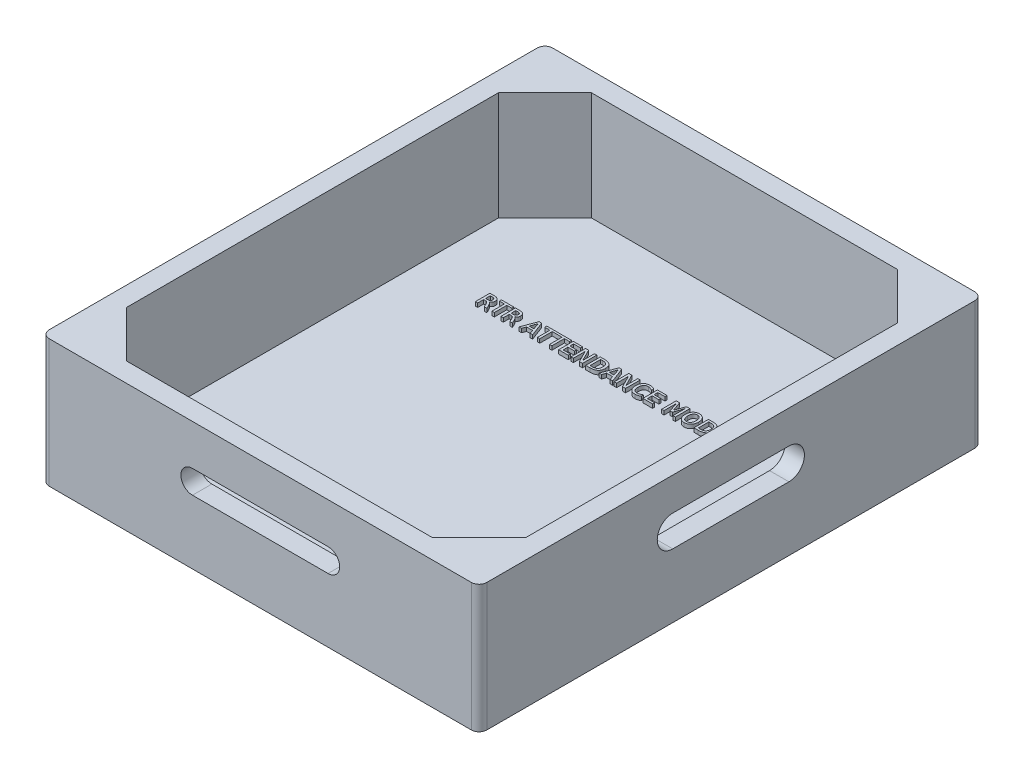
from build123d import *

# Parameters (mm, degrees)
SKETCH1_W           = 113
SKETCH1_H           = 130
BOSS_EXTRUDE1_DEPTH = 33
SKETCH3_W           = 103
SKETCH3_H           = 120
CUT_EXTRUDE1_DEPTH  = 28
FILLET1_R           = 2
BOSS_EXTRUDE3_DEPTH = 1
CUT_EXTRUDE2_DEPTH  = 5
CUT_EXTRUDE3_DEPTH  = 5
BOSS_EXTRUDE4_DEPTH = 28
SKETCH15_W          = 0.594668018
SKETCH15_H          = 3.104444445
BOSS_EXTRUDE5_DEPTH = 1


with BuildPart() as part:
    # Sketch1 → Boss-Extrude1 (new body)
    with BuildSketch(Plane(origin=(0, 0, 0), x_dir=(1, 0, 0), z_dir=(0, 1, 0))):
        Rectangle(SKETCH1_W, SKETCH1_H)
    extrude(amount=BOSS_EXTRUDE1_DEPTH)

    # Sketch3 → Cut-Extrude1 (cut)
    with BuildSketch(Plane(origin=(0, 33, 0), x_dir=(1, 0, 0), z_dir=(0, 1, 0))):
        Rectangle(SKETCH3_W, SKETCH3_H)
    extrude(amount=-CUT_EXTRUDE1_DEPTH, mode=Mode.SUBTRACT)

    # Fillet1
    fillet1_edges = [part.edges().sort_by_distance(p)[0] for p in [
        (56.5, 16.5, -65),
        (56.5, 16.5, 65),
        (-56.5, 16.5, -65),
        (-56.5, 16.5, 65),
    ]]
    fillet(fillet1_edges, radius=FILLET1_R)

    # Sketch4 → Boss-Extrude3 (add)
    # profile 1 of 19: a face of its own
    with BuildSketch(Plane(origin=(0, 5, 0), x_dir=(1, 0, 0), z_dir=(0, 1, 0))):
        with BuildLine():
            add(Edge.make_bspline(
                [(-32.923047636, 27.056317554), (-32.898890594, 27.050472865), (-32.847375237, 27.038008954), (-32.772781411, 26.993810456), (-32.696422663, 26.930265985), (-32.618503164, 26.847214155), (-32.539683411, 26.747956972), (-32.462319741, 26.634323858), (-32.38617643, 26.507851949), (-32.339896129, 26.417364967), (-32.315954763, 26.370554944)],
                knots=[0, 0, 0, 0, 0.63050352, 1.344560936, 2.182561549, 3.159190947, 4.240371206, 5.410358791, 6.660346928, 8, 8, 8, 8], degree=3))
            Line((-32.315954763, 26.370554944), (-31.798664136, 25.311482169))
            Line((-31.798664136, 25.311482169), (-32.458450889, 25.311482169))
            Line((-32.458450889, 25.311482169), (-32.917852465, 26.259229845))
            add(Edge.make_bspline(
                [(-32.917852465, 26.259229845), (-32.93253119, 26.287271571), (-32.960828525, 26.341329813), (-33.004416728, 26.418128165), (-33.048460389, 26.486738168), (-33.090342205, 26.54927505), (-33.133302279, 26.602902978), (-33.175218047, 26.649710655), (-33.216272212, 26.689196733), (-33.271803644, 26.731608035), (-33.349141245, 26.773157895), (-33.454565531, 26.807681448), (-33.57510988, 26.828284038), (-33.660428536, 26.83035295), (-33.705291998, 26.831440854)],
                knots=[0, 0, 0, 0, 1.090046005, 2.101367528, 3.039716005, 3.897563123, 4.691925366, 5.403731071, 6.060646833, 6.650245064, 7.805498799, 9.063704444, 10.455995536, 12, 12, 12, 12], degree=3))
            Line((-33.705291998, 26.831440854), (-34.1572719, 26.831440854))
            Line((-34.1572719, 26.831440854), (-34.1572719, 25.311482169))
            Line((-34.1572719, 25.311482169), (-34.774755116, 25.311482169))
            Line((-34.774755116, 25.311482169), (-34.774755116, 29.063880173))
            Line((-34.774755116, 29.063880173), (-33.626622261, 29.063880173))
            add(Edge.make_bspline(
                [(-33.626622261, 29.063880173), (-33.572908499, 29.063084947), (-33.468768503, 29.061543168), (-33.317775422, 29.04799613), (-33.177279422, 29.026262181), (-33.047227113, 28.994938535), (-32.927284214, 28.955557863), (-32.818526157, 28.905536), (-32.720049994, 28.847320828), (-32.632141189, 28.780301713), (-32.554202017, 28.705162362), (-32.487705864, 28.620924424), (-32.431027565, 28.528990437), (-32.384016135, 28.429313466), (-32.348377179, 28.321329995), (-32.323626364, 28.205600599), (-32.307555136, 28.082193823), (-32.30574867, 27.997190474), (-32.304822253, 27.953597852)],
                knots=[0, 0, 0, 0, 1.307144684, 2.534286147, 3.686579559, 4.764394583, 5.786917424, 6.754192308, 7.67223474, 8.565840745, 9.438778628, 10.300176618, 11.170785443, 12.062380764, 12.976366076, 13.93187438, 14.939394501, 16, 16, 16, 16], degree=3))
            add(Edge.make_bspline(
                [(-32.304822253, 27.953597852), (-32.305508727, 27.925136315), (-32.306854138, 27.869354957), (-32.314019741, 27.786937342), (-32.327611523, 27.708189668), (-32.345230735, 27.632109124), (-32.368996276, 27.559671615), (-32.398103138, 27.490212099), (-32.43235456, 27.423947103), (-32.471488298, 27.361092893), (-32.514816227, 27.302899581), (-32.562081196, 27.249997105), (-32.613538647, 27.203667899), (-32.667553497, 27.161115527), (-32.726803155, 27.126827045), (-32.788567288, 27.096644173), (-32.854221668, 27.072621609), (-32.899912201, 27.061798064), (-32.923047636, 27.056317554)],
                knots=[0, 0, 0, 0, 1.154960259, 2.263590099, 3.352646119, 4.394617018, 5.429359837, 6.441561682, 7.44712312, 8.452534268, 9.442190712, 10.387434813, 11.325242461, 12.2487068, 13.171352587, 14.096125104, 15.035971584, 16, 16, 16, 16], degree=3))
        make_face()
        with BuildLine():
            Line((-34.1572719, 28.541394375), (-34.1572719, 27.353926652))
            Line((-34.1572719, 27.353926652), (-33.616231919, 27.353926652))
            add(Edge.make_bspline(
                [(-33.616231919, 27.353926652), (-33.588257686, 27.354255927), (-33.533934907, 27.354895343), (-33.455111943, 27.362631779), (-33.38167819, 27.374245086), (-33.313494114, 27.390339754), (-33.250977581, 27.412027883), (-33.1936423, 27.437781516), (-33.141642548, 27.468392372), (-33.095546862, 27.504325655), (-33.054262466, 27.544331556), (-33.019329553, 27.589731465), (-32.988510095, 27.638609706), (-32.963974855, 27.692557826), (-32.945563973, 27.750951795), (-32.932394522, 27.813351193), (-32.923998107, 27.880145691), (-32.922882505, 27.926111518), (-32.922305469, 27.949887015)],
                knots=[0, 0, 0, 0, 1.283353638, 2.492126839, 3.630669031, 4.693565255, 5.702460263, 6.662721443, 7.573945684, 8.464133885, 9.339207683, 10.204505469, 11.086621048, 11.985813283, 12.915729454, 13.89104037, 14.909155611, 16, 16, 16, 16], degree=3))
            add(Edge.make_bspline(
                [(-32.922305469, 27.949887015), (-32.922900674, 27.973907374), (-32.924057856, 28.020607058), (-32.932248718, 28.088172374), (-32.945567506, 28.151051893), (-32.963999912, 28.2094273), (-32.988324267, 28.263255255), (-33.019346307, 28.31155488), (-33.054324682, 28.356150756), (-33.095307031, 28.395588376), (-33.142154881, 28.429690349), (-33.1934069, 28.460721497), (-33.251062202, 28.485424805), (-33.313509847, 28.50654194), (-33.381790328, 28.521543218), (-33.455053175, 28.533740505), (-33.533985234, 28.540138423), (-33.588267287, 28.540967339), (-33.616231919, 28.541394375)],
                knots=[0, 0, 0, 0, 1.103442655, 2.145281215, 3.121702571, 4.052677498, 4.952893508, 5.82637923, 6.683743186, 7.551888252, 8.429358133, 9.341619848, 10.29832699, 11.304718861, 12.366211849, 13.506050328, 14.7151852, 16, 16, 16, 16], degree=3))
            Line((-33.616231919, 28.541394375), (-34.1572719, 28.541394375))
        make_face(mode=Mode.SUBTRACT)
    # profile 2 of 19: a face of its own
    with BuildSketch(Plane(origin=(0, 5, 0), x_dir=(1, 0, 0), z_dir=(0, 1, 0))):
        Polygon((-31.80311714, 29.063880173), (-28.579142273, 29.063880173), (-28.579142273, 28.541394375), (-29.882388099, 28.541394375), (-29.882388099, 25.311482169), (-30.499871314, 25.311482169), (-30.499871314, 28.541394375), (-31.80311714, 28.541394375), align=None)
    # profile 3 of 19: a face of its own
    with BuildSketch(Plane(origin=(0, 5, 0), x_dir=(1, 0, 0), z_dir=(0, 1, 0))):
        with BuildLine():
            add(Edge.make_bspline(
                [(-26.320727098, 27.056317554), (-26.296570057, 27.050472865), (-26.245054699, 27.038008954), (-26.170460873, 26.993810456), (-26.094102126, 26.930265985), (-26.016182626, 26.847214155), (-25.937362873, 26.747956972), (-25.859999203, 26.634323858), (-25.783855892, 26.507851949), (-25.737575591, 26.417364967), (-25.713634225, 26.370554944)],
                knots=[0, 0, 0, 0, 0.63050352, 1.344560936, 2.182561549, 3.159190947, 4.240371206, 5.410358791, 6.660346928, 8, 8, 8, 8], degree=3))
            Line((-25.713634225, 26.370554944), (-25.196343598, 25.311482169))
            Line((-25.196343598, 25.311482169), (-25.856130352, 25.311482169))
            Line((-25.856130352, 25.311482169), (-26.315531927, 26.259229845))
            add(Edge.make_bspline(
                [(-26.315531927, 26.259229845), (-26.330210652, 26.287271571), (-26.358507987, 26.341329813), (-26.40209619, 26.418128165), (-26.446139851, 26.486738168), (-26.488021667, 26.54927505), (-26.530981741, 26.602902978), (-26.572897509, 26.649710655), (-26.613951674, 26.689196733), (-26.669483106, 26.731608035), (-26.746820707, 26.773157895), (-26.852244993, 26.807681448), (-26.972789342, 26.828284038), (-27.058107998, 26.83035295), (-27.10297146, 26.831440854)],
                knots=[0, 0, 0, 0, 1.090046005, 2.101367528, 3.039716005, 3.897563123, 4.691925366, 5.403731071, 6.060646833, 6.650245064, 7.805498799, 9.063704444, 10.455995536, 12, 12, 12, 12], degree=3))
            Line((-27.10297146, 26.831440854), (-27.554951362, 26.831440854))
            Line((-27.554951362, 26.831440854), (-27.554951362, 25.311482169))
            Line((-27.554951362, 25.311482169), (-28.172434578, 25.311482169))
            Line((-28.172434578, 25.311482169), (-28.172434578, 29.063880173))
            Line((-28.172434578, 29.063880173), (-27.024301724, 29.063880173))
            add(Edge.make_bspline(
                [(-27.024301724, 29.063880173), (-26.970587962, 29.063084947), (-26.866447965, 29.061543168), (-26.715454885, 29.04799613), (-26.574958884, 29.026262181), (-26.444906575, 28.994938535), (-26.324963676, 28.955557863), (-26.216205619, 28.905536), (-26.117729456, 28.847320828), (-26.029820651, 28.780301713), (-25.951881479, 28.705162362), (-25.885385326, 28.620924424), (-25.828707028, 28.528990437), (-25.781695598, 28.429313466), (-25.746056642, 28.321329995), (-25.721305826, 28.205600599), (-25.705234599, 28.082193823), (-25.703428133, 27.997190474), (-25.702501715, 27.953597852)],
                knots=[0, 0, 0, 0, 1.307144684, 2.534286147, 3.686579559, 4.764394583, 5.786917424, 6.754192308, 7.67223474, 8.565840745, 9.438778628, 10.300176618, 11.170785443, 12.062380764, 12.976366076, 13.93187438, 14.939394501, 16, 16, 16, 16], degree=3))
            add(Edge.make_bspline(
                [(-25.702501715, 27.953597852), (-25.703188189, 27.925136315), (-25.7045336, 27.869354957), (-25.711699203, 27.786937342), (-25.725290985, 27.708189668), (-25.742910197, 27.632109124), (-25.766675738, 27.559671615), (-25.7957826, 27.490212099), (-25.830034023, 27.423947103), (-25.869167761, 27.361092893), (-25.912495689, 27.302899581), (-25.959760658, 27.249997105), (-26.01121811, 27.203667899), (-26.065232959, 27.161115527), (-26.124482617, 27.126827045), (-26.18624675, 27.096644173), (-26.25190113, 27.072621609), (-26.297591664, 27.061798064), (-26.320727098, 27.056317554)],
                knots=[0, 0, 0, 0, 1.154960259, 2.263590099, 3.352646119, 4.394617018, 5.429359837, 6.441561682, 7.44712312, 8.452534268, 9.442190712, 10.387434813, 11.325242461, 12.2487068, 13.171352587, 14.096125104, 15.035971584, 16, 16, 16, 16], degree=3))
        make_face()
        with BuildLine():
            Line((-27.554951362, 28.541394375), (-27.554951362, 27.353926652))
            Line((-27.554951362, 27.353926652), (-27.013911381, 27.353926652))
            add(Edge.make_bspline(
                [(-27.013911381, 27.353926652), (-26.985937148, 27.354255927), (-26.931614369, 27.354895343), (-26.852791406, 27.362631779), (-26.779357653, 27.374245086), (-26.711173576, 27.390339754), (-26.648657043, 27.412027883), (-26.591321762, 27.437781516), (-26.53932201, 27.468392372), (-26.493226324, 27.504325655), (-26.451941928, 27.544331556), (-26.417009015, 27.589731465), (-26.386189557, 27.638609706), (-26.361654317, 27.692557826), (-26.343243435, 27.750951795), (-26.330073984, 27.813351193), (-26.321677569, 27.880145691), (-26.320561968, 27.926111518), (-26.319984931, 27.949887015)],
                knots=[0, 0, 0, 0, 1.283353638, 2.492126839, 3.630669031, 4.693565255, 5.702460263, 6.662721443, 7.573945684, 8.464133885, 9.339207683, 10.204505469, 11.086621048, 11.985813283, 12.915729454, 13.89104037, 14.909155611, 16, 16, 16, 16], degree=3))
            add(Edge.make_bspline(
                [(-26.319984931, 27.949887015), (-26.320580136, 27.973907374), (-26.321737318, 28.020607058), (-26.32992818, 28.088172374), (-26.343246968, 28.151051893), (-26.361679374, 28.2094273), (-26.386003729, 28.263255255), (-26.417025769, 28.31155488), (-26.452004144, 28.356150756), (-26.492986493, 28.395588376), (-26.539834344, 28.429690349), (-26.591086363, 28.460721497), (-26.648741664, 28.485424805), (-26.711189309, 28.50654194), (-26.77946979, 28.521543218), (-26.852732638, 28.533740505), (-26.931664696, 28.540138423), (-26.985946749, 28.540967339), (-27.013911381, 28.541394375)],
                knots=[0, 0, 0, 0, 1.103442655, 2.145281215, 3.121702571, 4.052677498, 4.952893508, 5.82637923, 6.683743186, 7.551888252, 8.429358133, 9.341619848, 10.29832699, 11.304718861, 12.366211849, 13.506050328, 14.7151852, 16, 16, 16, 16], degree=3))
            Line((-27.013911381, 28.541394375), (-27.554951362, 28.541394375))
        make_face(mode=Mode.SUBTRACT)
    # profile 4 of 19: a face of its own
    with BuildSketch(Plane(origin=(0, 5, 0), x_dir=(1, 0, 0), z_dir=(0, 1, 0))):
        Polygon((-22.062170978, 29.063880173), (-21.393478217, 29.063880173), (-19.972227786, 25.311482169), (-20.61791336, 25.311482169), (-20.952630825, 26.261456347), (-22.497081031, 26.261456347), (-22.831798496, 25.311482169), (-23.478226237, 25.311482169), align=None)
        Polygon((-21.727453514, 28.51764502), (-22.327866881, 26.783942145), (-21.12332931, 26.783942145), align=None, mode=Mode.SUBTRACT)
    # profile 5 of 19: a face of its own
    with BuildSketch(Plane(origin=(0, 5, 0), x_dir=(1, 0, 0), z_dir=(0, 1, 0))):
        Polygon((-20.07093604, 29.063880173), (-16.846961174, 29.063880173), (-16.846961174, 28.541394375), (-18.150206999, 28.541394375), (-18.150206999, 25.311482169), (-18.767690215, 25.311482169), (-18.767690215, 28.541394375), (-20.07093604, 28.541394375), align=None)
    # profile 6 of 19: a face of its own
    with BuildSketch(Plane(origin=(0, 5, 0), x_dir=(1, 0, 0), z_dir=(0, 1, 0))):
        Polygon((-16.936021253, 29.063880173), (-13.712046386, 29.063880173), (-13.712046386, 28.541394375), (-15.015292211, 28.541394375), (-15.015292211, 25.311482169), (-15.632775427, 25.311482169), (-15.632775427, 28.541394375), (-16.936021253, 28.541394375), align=None)
    # profile 7 of 19: a face of its own
    with BuildSketch(Plane(origin=(0, 5, 0), x_dir=(1, 0, 0), z_dir=(0, 1, 0))):
        Polygon((-13.257839982, 29.063880173), (-10.816109477, 29.063880173), (-10.816109477, 28.541394375), (-12.640356766, 28.541394375), (-12.640356766, 27.591420197), (-10.89032621, 27.591420197), (-10.89032621, 27.068934399), (-12.640356766, 27.068934399), (-12.640356766, 25.833967967), (-10.772321605, 25.833967967), (-10.772321605, 25.311482169), (-13.257839982, 25.311482169), align=None)
    # profile 8 of 19: a face of its own
    with BuildSketch(Plane(origin=(0, 5, 0), x_dir=(1, 0, 0), z_dir=(0, 1, 0))):
        Polygon((-10.075426485, 29.063880173), (-9.280565279, 29.063880173), (-7.747989749, 26.004666452), (-7.747989749, 29.063880173), (-7.130506533, 29.063880173), (-7.130506533, 25.311482169), (-7.932047246, 25.311482169), (-9.45794327, 28.37069589), (-9.45794327, 25.311482169), (-10.075426485, 25.311482169), align=None)
    # profile 9 of 19: a face of its own
    with BuildSketch(Plane(origin=(0, 5, 0), x_dir=(1, 0, 0), z_dir=(0, 1, 0))):
        with BuildLine():
            Line((-6.275529773, 29.063880173), (-5.205324488, 29.063880173))
            add(Edge.make_bspline(
                [(-5.205324488, 29.063880173), (-5.159548579, 29.06375065), (-5.069686937, 29.063496388), (-4.937317263, 29.056894026), (-4.809570747, 29.048432362), (-4.686308208, 29.035733116), (-4.567682277, 29.019692815), (-4.453704142, 28.999160876), (-4.343980489, 28.9769675), (-4.239453973, 28.949057876), (-4.139335245, 28.918669955), (-4.043848051, 28.884816523), (-3.952971222, 28.846803503), (-3.866701502, 28.805273624), (-3.784935451, 28.759922974), (-3.707616411, 28.711186462), (-3.63562779, 28.658105994), (-3.545188583, 28.584083485), (-3.442814874, 28.480563602), (-3.335868556, 28.341449678), (-3.245470849, 28.187091663), (-3.171951212, 28.017305789), (-3.115057453, 27.832302974), (-3.074755041, 27.632434997), (-3.049896399, 27.417638074), (-3.047074169, 27.26938984), (-3.045617567, 27.192876342)],
                knots=[0, 0, 0, 0, 1.002514974, 1.968014241, 2.902293287, 3.806499264, 4.681645962, 5.523514741, 6.342883433, 7.132785462, 7.892116815, 8.634239064, 9.350756199, 10.048736446, 10.730306856, 11.397751388, 12.049121289, 12.688112485, 13.956373785, 15.227687407, 16.52225381, 17.864184992, 19.271301322, 20.753774224, 22.324566282, 24, 24, 24, 24], degree=3))
            add(Edge.make_bspline(
                [(-3.045617567, 27.192876342), (-3.046109102, 27.153783317), (-3.047077182, 27.076789504), (-3.052804876, 26.963361504), (-3.063537621, 26.853743084), (-3.077120277, 26.747905486), (-3.095995795, 26.645966795), (-3.118147372, 26.547573519), (-3.144418499, 26.453020498), (-3.176179371, 26.36261173), (-3.210896192, 26.275852385), (-3.249176135, 26.192523572), (-3.292746044, 26.113438809), (-3.339880652, 26.037965905), (-3.391425676, 25.966506234), (-3.446400649, 25.898598071), (-3.505910649, 25.834612134), (-3.569917571, 25.77472749), (-3.637422018, 25.717597074), (-3.710795569, 25.666038978), (-3.787679632, 25.616987788), (-3.869283442, 25.571568191), (-3.955166972, 25.528950496), (-4.046465721, 25.491626915), (-4.142096729, 25.457380535), (-4.241941521, 25.425926339), (-4.346748003, 25.399897722), (-4.45573772, 25.375550053), (-4.569468672, 25.355957122), (-4.687778379, 25.339568329), (-4.810559954, 25.326908306), (-4.938059032, 25.318470065), (-5.070182036, 25.311876912), (-5.159796082, 25.311615155), (-5.205324488, 25.311482169)],
                knots=[0, 0, 0, 0, 1.138950542, 2.243165959, 3.307425501, 4.347119523, 5.350817856, 6.326435506, 7.284755694, 8.207874555, 9.116616875, 10.006588066, 10.877443237, 11.745310903, 12.597383286, 13.442723201, 14.289260503, 15.140723044, 15.995230446, 16.86321781, 17.750968307, 18.65121108, 19.582732288, 20.542406611, 21.522698414, 22.541676962, 23.590498809, 24.667735387, 25.794581284, 26.951451341, 28.146942513, 29.389602611, 30.673787906, 32, 32, 32, 32], degree=3))
            Line((-5.205324488, 25.311482169), (-6.275529773, 25.311482169))
            Line((-6.275529773, 25.311482169), (-6.275529773, 29.063880173))
        make_face()
        with BuildLine():
            Line((-5.658046557, 28.541394375), (-5.658046557, 25.833967967))
            Line((-5.658046557, 25.833967967), (-5.145951102, 25.833967967))
            add(Edge.make_bspline(
                [(-5.145951102, 25.833967967), (-5.085310326, 25.834959852), (-4.968289371, 25.836873931), (-4.799128328, 25.851631688), (-4.642758193, 25.876511898), (-4.499008261, 25.911642035), (-4.368326863, 25.957842195), (-4.249909418, 26.01323401), (-4.144619236, 26.07973196), (-4.050739899, 26.155977639), (-3.970313008, 26.244981608), (-3.899504236, 26.344480581), (-3.841044453, 26.457136866), (-3.792931345, 26.5813425), (-3.756088357, 26.71749483), (-3.729746251, 26.865241712), (-3.713121232, 27.025014673), (-3.711458639, 27.135686516), (-3.710599492, 27.192876342)],
                knots=[0, 0, 0, 0, 1.272738175, 2.45605428, 3.560727633, 4.593454583, 5.557528065, 6.465721661, 7.331554025, 8.165306722, 8.995948875, 9.84166282, 10.721995315, 11.652552351, 12.632645011, 13.677661894, 14.799928604, 16, 16, 16, 16], degree=3))
            add(Edge.make_bspline(
                [(-3.710599492, 27.192876342), (-3.7114559, 27.24957171), (-3.713112742, 27.359256986), (-3.729787345, 27.517794423), (-3.756142406, 27.664531437), (-3.792597449, 27.799607579), (-3.841413592, 27.922306201), (-3.899481724, 28.033878827), (-3.970298906, 28.132678017), (-4.051015576, 28.220831196), (-4.144362442, 28.297268522), (-4.250190139, 28.362640144), (-4.368317162, 28.418699928), (-4.49952527, 28.463178524), (-4.642936606, 28.499071197), (-4.799388205, 28.52373005), (-4.96853599, 28.538448174), (-5.085557112, 28.540391457), (-5.145951102, 28.541394375)],
                knots=[0, 0, 0, 0, 1.194364391, 2.31066828, 3.354661843, 4.333578847, 5.253234685, 6.132416358, 6.977200828, 7.807268, 8.644296059, 9.510758424, 10.422519819, 11.393576372, 12.425302095, 13.534315111, 14.727472923, 16, 16, 16, 16], degree=3))
            Line((-5.145951102, 28.541394375), (-5.658046557, 28.541394375))
        make_face(mode=Mode.SUBTRACT)
    # profile 10 of 19: a face of its own
    with BuildSketch(Plane(origin=(0, 5, 0), x_dir=(1, 0, 0), z_dir=(0, 1, 0))):
        Polygon((-1.400232604, 29.063880173), (-0.731539843, 29.063880173), (0.689710588, 25.311482169), (0.044025013, 25.311482169), (-0.290692451, 26.261456347), (-1.835142658, 26.261456347), (-2.169860122, 25.311482169), (-2.816287864, 25.311482169), align=None)
        Polygon((-1.06551514, 28.51764502), (-1.665928507, 26.783942145), (-0.461390936, 26.783942145), align=None, mode=Mode.SUBTRACT)
    # profile 11 of 19: a face of its own
    with BuildSketch(Plane(origin=(0, 5, 0), x_dir=(1, 0, 0), z_dir=(0, 1, 0))):
        Polygon((1.086770107, 29.063880173), (1.881631314, 29.063880173), (3.414206844, 26.004666452), (3.414206844, 29.063880173), (4.031690059, 29.063880173), (4.031690059, 25.311482169), (3.230149347, 25.311482169), (1.704253323, 28.37069589), (1.704253323, 25.311482169), (1.086770107, 25.311482169), align=None)
    # profile 12 of 19: a face of its own
    with BuildSketch(Plane(origin=(0, 5, 0), x_dir=(1, 0, 0), z_dir=(0, 1, 0))):
        with BuildLine():
            Line((7.795220573, 28.768497577), (7.795220573, 28.179958887))
            add(Edge.make_bspline(
                [(7.795220573, 28.179958887), (7.735358043, 28.217238432), (7.620949056, 28.288486926), (7.453167888, 28.383933617), (7.297313668, 28.463156621), (7.15088252, 28.527115926), (7.008658373, 28.577355839), (6.864324514, 28.611076091), (6.716035522, 28.632880004), (6.615499554, 28.635213083), (6.564707145, 28.636391793)],
                knots=[0, 0, 0, 0, 1.270462105, 2.428101238, 3.476566177, 4.41881353, 5.305413206, 6.189724474, 7.085419318, 8, 8, 8, 8], degree=3))
            add(Edge.make_bspline(
                [(6.564707145, 28.636391793), (6.518389723, 28.635254965), (6.427903565, 28.633034048), (6.296210491, 28.615643467), (6.172513192, 28.587877875), (6.056782937, 28.548080687), (5.948767975, 28.497261156), (5.849660179, 28.433342086), (5.757978098, 28.359267167), (5.67478503, 28.273572083), (5.60009441, 28.176754444), (5.535987164, 28.067902468), (5.482217029, 27.947997176), (5.437272515, 27.817191677), (5.403761904, 27.6749002), (5.379547618, 27.52159061), (5.364564239, 27.357190885), (5.362643866, 27.243871245), (5.361653909, 27.185454669)],
                knots=[0, 0, 0, 0, 1.03539897, 2.022765311, 2.964802532, 3.865744381, 4.754047227, 5.627201118, 6.496332897, 7.384342878, 8.291630956, 9.224216633, 10.202115797, 11.22550491, 12.312295424, 13.466382171, 14.693913249, 16, 16, 16, 16], degree=3))
            add(Edge.make_bspline(
                [(5.361653909, 27.185454669), (5.362642792, 27.12728506), (5.364560844, 27.014458474), (5.379553698, 26.850802517), (5.403729364, 26.698219499), (5.437423662, 26.556481252), (5.482032665, 26.42605086), (5.536144588, 26.306525188), (5.600170857, 26.198124264), (5.673966772, 26.100785567), (5.757336507, 26.015479969), (5.848755373, 25.940878691), (5.948769582, 25.878695304), (6.056327551, 25.826831645), (6.172347813, 25.787682747), (6.295955706, 25.759754759), (6.42765215, 25.742258273), (6.518141696, 25.740087578), (6.564707145, 25.738970549)],
                knots=[0, 0, 0, 0, 1.302859988, 2.527045431, 3.677703953, 4.761031818, 5.786232835, 6.760818993, 7.695055808, 8.600582096, 9.490164293, 10.360834864, 11.23725331, 12.12212814, 13.02990688, 13.973611973, 14.957231273, 16, 16, 16, 16], degree=3))
            add(Edge.make_bspline(
                [(6.564707145, 25.738970549), (6.615745868, 25.740151329), (6.71677232, 25.742488574), (6.865810387, 25.764263571), (7.010310524, 25.797962607), (7.152498922, 25.847374601), (7.298267203, 25.911347026), (7.452870408, 25.991949034), (7.62141493, 26.085823816), (7.735448415, 26.157718767), (7.795220573, 26.195403455)],
                knots=[0, 0, 0, 0, 0.918844899, 1.818768851, 2.707233994, 3.587988384, 4.525954765, 5.572251568, 6.727463576, 8, 8, 8, 8], degree=3))
            Line((7.795220573, 26.195403455), (7.795220573, 25.610575602))
            add(Edge.make_bspline(
                [(7.795220573, 25.610575602), (7.745973273, 25.578120479), (7.648827966, 25.514099448), (7.497000004, 25.433093904), (7.344614924, 25.363874022), (7.189765224, 25.309549819), (7.032167219, 25.267703078), (6.870628015, 25.238187172), (6.704415277, 25.219775508), (6.591968028, 25.217591046), (6.535020452, 25.216484751)],
                knots=[0, 0, 0, 0, 1.054615395, 2.080336105, 3.074769445, 4.046177444, 5.012318731, 5.988864762, 6.981484412, 8, 8, 8, 8], degree=3))
            add(Edge.make_bspline(
                [(6.535020452, 25.216484751), (6.465412575, 25.21786076), (6.329672817, 25.220544065), (6.132103634, 25.246990887), (5.945214368, 25.286603076), (5.770416915, 25.345957925), (5.606219965, 25.420095551), (5.454082681, 25.512177477), (5.31299908, 25.620224261), (5.184384018, 25.744578736), (5.069745927, 25.883201853), (4.969382279, 26.034400011), (4.884831898, 26.197452398), (4.815297959, 26.372440206), (4.762446451, 26.559349245), (4.723865281, 26.757652289), (4.700514493, 26.967686513), (4.697973879, 27.111671816), (4.696671984, 27.185454669)],
                knots=[0, 0, 0, 0, 1.095305685, 2.135915299, 3.132926493, 4.09856371, 5.036264873, 5.964077588, 6.891898479, 7.82844219, 8.77446246, 9.718604668, 10.680235352, 11.660985254, 12.678032064, 13.733686998, 14.838665921, 16, 16, 16, 16], degree=3))
            add(Edge.make_bspline(
                [(4.696671984, 27.185454669), (4.697974629, 27.259484545), (4.700516893, 27.40396257), (4.723861888, 27.614738046), (4.762466905, 27.813772877), (4.81516886, 28.001224266), (4.884805863, 28.176448711), (4.969617461, 28.339564043), (5.069458009, 28.491376206), (5.184666462, 28.630009042), (5.312725797, 28.755166838), (5.454112949, 28.863168821), (5.606234546, 28.9551978), (5.770254274, 29.029671422), (5.945480759, 29.087550548), (6.131967115, 29.12870414), (6.329695304, 29.154726533), (6.465420198, 29.157470483), (6.535020452, 29.15887759)],
                knots=[0, 0, 0, 0, 1.163706767, 2.271110862, 3.329206523, 4.348666197, 5.328136717, 6.28851296, 7.23466744, 8.179453633, 9.117481364, 10.044091918, 10.970694308, 11.907172246, 12.870317374, 13.866870989, 14.906123134, 16, 16, 16, 16], degree=3))
            add(Edge.make_bspline(
                [(6.535020452, 29.15887759), (6.592463968, 29.157782751), (6.705654492, 29.155625408), (6.872839102, 29.13713164), (7.034700219, 29.107902395), (7.191863056, 29.065643249), (7.346277732, 29.012141478), (7.497978181, 28.944025572), (7.649273336, 28.863947864), (7.745970686, 28.800707271), (7.795220573, 28.768497577)],
                knots=[0, 0, 0, 0, 1.028451697, 2.026529615, 3.008469109, 3.971354114, 4.938145032, 5.931827803, 6.946638698, 8, 8, 8, 8], degree=3))
        make_face()
    # profile 13 of 19: a face of its own
    with BuildSketch(Plane(origin=(0, 5, 0), x_dir=(1, 0, 0), z_dir=(0, 1, 0))):
        Polygon((8.496568696, 29.063880173), (10.938299201, 29.063880173), (10.938299201, 28.541394375), (9.114051912, 28.541394375), (9.114051912, 27.591420197), (10.864082468, 27.591420197), (10.864082468, 27.068934399), (9.114051912, 27.068934399), (9.114051912, 25.833967967), (10.982087073, 25.833967967), (10.982087073, 25.311482169), (8.496568696, 25.311482169), align=None)
    # profile 14 of 19: a face of its own
    with BuildSketch(Plane(origin=(0, 5, 0), x_dir=(1, 0, 0), z_dir=(0, 1, 0))):
        Polygon((13.341437005, 29.063880173), (14.210514944, 29.063880173), (15.09443623, 26.573166624), (15.988005691, 29.063880173), (16.856341464, 29.063880173), (16.856341464, 25.311482169), (16.238858248, 25.311482169), (16.238858248, 28.522840192), (15.401693503, 26.00540862), (14.791631961, 26.00540862), (13.95892022, 28.522840192), (13.95892022, 25.311482169), (13.341437005, 25.311482169), align=None)
    # profile 15 of 19: a face of its own
    with BuildSketch(Plane(origin=(0, 5, 0), x_dir=(1, 0, 0), z_dir=(0, 1, 0))):
        with BuildLine():
            add(Edge.make_bspline(
                [(19.233503411, 29.15887759), (19.299408916, 29.15754029), (19.428296715, 29.154925004), (19.616081672, 29.127737024), (19.793847114, 29.086501437), (19.960287628, 29.025472309), (20.116927029, 28.949081458), (20.262004803, 28.854037159), (20.39702019, 28.74258474), (20.519309929, 28.614059337), (20.629852545, 28.472687647), (20.725764386, 28.319481804), (20.808315063, 28.15636991), (20.873551699, 27.981808642), (20.926415441, 27.797598802), (20.961587879, 27.602630044), (20.984839511, 27.397534922), (20.98741211, 27.257265093), (20.988729138, 27.185454669)],
                knots=[0, 0, 0, 0, 1.061796037, 2.076496564, 3.052556462, 3.998802472, 4.928086254, 5.856205347, 6.788147026, 7.74438438, 8.71052622, 9.676536339, 10.653964204, 11.652451486, 12.67635916, 13.739412842, 14.842703919, 16, 16, 16, 16], degree=3))
            add(Edge.make_bspline(
                [(20.988729138, 27.185454669), (20.987409916, 27.113892161), (20.984833221, 26.97411682), (20.961616596, 26.769750871), (20.926277595, 26.575324591), (20.873752714, 26.391495037), (20.8081397, 26.217698592), (20.726481514, 26.054775739), (20.630506648, 25.902003553), (20.520362168, 25.760499057), (20.397209089, 25.632896329), (20.263274131, 25.52037204), (20.117382908, 25.426458639), (19.961074932, 25.349825239), (19.794576673, 25.288878992), (19.61682745, 25.247620185), (19.428792535, 25.220403379), (19.299656643, 25.217812167), (19.233503411, 25.216484751)],
                knots=[0, 0, 0, 0, 1.15471466, 2.255379805, 3.315803226, 4.34095782, 5.336929758, 6.310188921, 7.277375452, 8.244693865, 9.199218452, 10.134846372, 11.061922531, 11.992337999, 12.939736352, 13.916984902, 14.932921136, 16, 16, 16, 16], degree=3))
            add(Edge.make_bspline(
                [(19.233503411, 25.216484751), (19.170082344, 25.217909392), (19.046175548, 25.220692736), (18.865128499, 25.246669403), (18.693943925, 25.288643868), (18.532413614, 25.347639935), (18.380560008, 25.422897884), (18.238611399, 25.51562477), (18.10683227, 25.625606656), (17.985202075, 25.750810066), (17.876512547, 25.890476454), (17.780666274, 26.041817139), (17.700729468, 26.205356252), (17.634374033, 26.379670016), (17.58329923, 26.565342745), (17.547253513, 26.762006004), (17.525500923, 26.969983268), (17.522739352, 27.112421245), (17.521323388, 27.185454669)],
                knots=[0, 0, 0, 0, 1.034645843, 2.021404849, 2.978207153, 3.906888496, 4.822423601, 5.738546198, 6.667587377, 7.618475419, 8.582103622, 9.551131006, 10.537104853, 11.547998111, 12.591314114, 13.675515096, 14.808147271, 16, 16, 16, 16], degree=3))
            add(Edge.make_bspline(
                [(17.521323388, 27.185454669), (17.522781251, 27.258235311), (17.525634175, 27.400661354), (17.54693975, 27.608751846), (17.584213207, 27.805503189), (17.635283096, 27.991067275), (17.700511623, 28.165742867), (17.780960512, 28.329164364), (17.876383154, 28.48142719), (17.985990771, 28.621335316), (18.107557023, 28.747465221), (18.239071784, 28.858402656), (18.38173327, 28.950631476), (18.532722957, 29.028086367), (18.694748233, 29.086596127), (18.865853368, 29.128727179), (19.046676916, 29.154624914), (19.170331926, 29.157439637), (19.233503411, 29.15887759)],
                knots=[0, 0, 0, 0, 1.186818688, 2.322511668, 3.40654475, 4.448983717, 5.457600003, 6.442745017, 7.414372889, 8.38285463, 9.33584278, 10.266685784, 11.182038266, 12.100426458, 13.028327129, 13.984325123, 14.970254636, 16, 16, 16, 16], degree=3))
        make_face()
        with BuildLine():
            add(Edge.make_bspline(
                [(19.255026263, 28.636391793), (19.216362042, 28.635297248), (19.140341626, 28.633145186), (19.029033052, 28.614772905), (18.923103766, 28.585255986), (18.822810325, 28.543475773), (18.728822396, 28.489226971), (18.639532987, 28.424537459), (18.557098119, 28.346290757), (18.480120172, 28.257434559), (18.409979172, 28.157897775), (18.349942957, 28.047422934), (18.299744921, 27.927358673), (18.257892646, 27.797813761), (18.225546437, 27.658526364), (18.203033166, 27.50938115), (18.188435276, 27.350754306), (18.187029366, 27.241646108), (18.186305313, 27.185454669)],
                knots=[0, 0, 0, 0, 0.91591683, 1.800847785, 2.665876421, 3.517445742, 4.368368834, 5.232721527, 6.124618416, 7.055724628, 8.015486943, 9.004761227, 10.029542525, 11.095759001, 12.227896246, 13.414611162, 14.668507768, 16, 16, 16, 16], degree=3))
            add(Edge.make_bspline(
                [(18.186305313, 27.185454669), (18.187045023, 27.129758691), (18.188487523, 27.021146647), (18.202984921, 26.863254563), (18.22552005, 26.714594247), (18.258040945, 26.575859028), (18.299554425, 26.446686271), (18.350147068, 26.327040218), (18.409938124, 26.216691275), (18.480190219, 26.117264827), (18.556758876, 26.028184674), (18.640039956, 25.951298209), (18.727764059, 25.884655823), (18.822970421, 25.832320516), (18.922832503, 25.790147444), (19.028522494, 25.760500709), (19.139845214, 25.742189114), (19.216114162, 25.740057891), (19.255026263, 25.738970549)],
                knots=[0, 0, 0, 0, 1.322366405, 2.578730535, 3.761975346, 4.890620791, 5.95893546, 6.980323806, 7.971544869, 8.933195887, 9.866134409, 10.755779846, 11.620597092, 12.475418435, 13.328663548, 14.189740918, 15.076413316, 16, 16, 16, 16], degree=3))
            add(Edge.make_bspline(
                [(19.255026263, 25.738970549), (19.2966665, 25.739980761), (19.378399853, 25.74196365), (19.497227437, 25.761343979), (19.6100051, 25.790642345), (19.715672713, 25.833151603), (19.814927121, 25.887928018), (19.906938202, 25.955240933), (19.993228807, 26.033738706), (20.071510113, 26.124452857), (20.141870496, 26.225566356), (20.203955155, 26.335977321), (20.255576637, 26.455783187), (20.297940793, 26.584496528), (20.331279232, 26.72197337), (20.354671489, 26.868632196), (20.369027581, 27.024115477), (20.370493752, 27.130749535), (20.371245923, 27.185454669)],
                knots=[0, 0, 0, 0, 0.970430158, 1.904804516, 2.800523305, 3.683383011, 4.55371009, 5.437756803, 6.336258775, 7.268760726, 8.225944369, 9.204998314, 10.217944855, 11.263431396, 12.361974668, 13.51352963, 14.724397288, 16, 16, 16, 16], degree=3))
            add(Edge.make_bspline(
                [(20.371245923, 27.185454669), (20.370494023, 27.240407256), (20.369028222, 27.347535297), (20.354664067, 27.503755659), (20.331295879, 27.651164504), (20.297872563, 27.789343548), (20.255945163, 27.918492132), (20.203531527, 28.038187863), (20.142113123, 28.148930162), (20.071527916, 28.250209574), (19.992941172, 28.340796579), (19.907454733, 28.420270768), (19.814321739, 28.486675349), (19.715494144, 28.542007861), (19.609593932, 28.58499957), (19.496928755, 28.61379085), (19.378169338, 28.633480173), (19.29667126, 28.63540713), (19.255026263, 28.636391793)],
                knots=[0, 0, 0, 0, 1.278897747, 2.493163933, 3.648181285, 4.750201061, 5.799138024, 6.804851357, 7.787042806, 8.742379355, 9.673081843, 10.573742914, 11.452713391, 12.329190222, 13.205004668, 14.104560453, 15.031442497, 16, 16, 16, 16], degree=3))
        make_face(mode=Mode.SUBTRACT)
    # profile 16 of 19: a face of its own
    with BuildSketch(Plane(origin=(0, 5, 0), x_dir=(1, 0, 0), z_dir=(0, 1, 0))):
        with BuildLine():
            Line((21.653711063, 29.063880173), (22.723916348, 29.063880173))
            add(Edge.make_bspline(
                [(22.723916348, 29.063880173), (22.769692257, 29.06375065), (22.859553899, 29.063496388), (22.991923573, 29.056894026), (23.119670089, 29.048432362), (23.242932628, 29.035733116), (23.361558559, 29.019692815), (23.475536694, 28.999160876), (23.585260347, 28.9769675), (23.689786863, 28.949057876), (23.789905591, 28.918669955), (23.885392785, 28.884816523), (23.976269614, 28.846803503), (24.062539333, 28.805273624), (24.144305385, 28.759922974), (24.221624425, 28.711186462), (24.293613046, 28.658105994), (24.384052253, 28.584083485), (24.486425962, 28.480563602), (24.59337228, 28.341449678), (24.683769987, 28.187091663), (24.757289624, 28.017305789), (24.814183383, 27.832302974), (24.854485795, 27.632434997), (24.879344437, 27.417638074), (24.882166667, 27.26938984), (24.883623269, 27.192876342)],
                knots=[0, 0, 0, 0, 1.002514974, 1.968014241, 2.902293287, 3.806499264, 4.681645962, 5.523514741, 6.342883433, 7.132785462, 7.892116815, 8.634239064, 9.350756199, 10.048736446, 10.730306856, 11.397751388, 12.049121289, 12.688112485, 13.956373785, 15.227687407, 16.52225381, 17.864184992, 19.271301322, 20.753774224, 22.324566282, 24, 24, 24, 24], degree=3))
            add(Edge.make_bspline(
                [(24.883623269, 27.192876342), (24.883131734, 27.153783317), (24.882163654, 27.076789504), (24.87643596, 26.963361504), (24.865703215, 26.853743084), (24.852120559, 26.747905486), (24.833245041, 26.645966795), (24.811093464, 26.547573519), (24.784822337, 26.453020498), (24.753061465, 26.36261173), (24.718344644, 26.275852385), (24.680064701, 26.192523572), (24.636494792, 26.113438809), (24.589360184, 26.037965905), (24.53781516, 25.966506234), (24.482840187, 25.898598071), (24.423330187, 25.834612134), (24.359323265, 25.77472749), (24.291818818, 25.717597074), (24.218445267, 25.666038978), (24.141561204, 25.616987788), (24.059957394, 25.571568191), (23.974073864, 25.528950496), (23.882775115, 25.491626915), (23.787144107, 25.457380535), (23.687299315, 25.425926339), (23.582492833, 25.399897722), (23.473503116, 25.375550053), (23.359772164, 25.355957122), (23.241462457, 25.339568329), (23.118680882, 25.326908306), (22.991181804, 25.318470065), (22.8590588, 25.311876912), (22.769444754, 25.311615155), (22.723916348, 25.311482169)],
                knots=[0, 0, 0, 0, 1.138950542, 2.243165959, 3.307425501, 4.347119523, 5.350817856, 6.326435506, 7.284755694, 8.207874555, 9.116616875, 10.006588066, 10.877443237, 11.745310903, 12.597383286, 13.442723201, 14.289260503, 15.140723044, 15.995230446, 16.86321781, 17.750968307, 18.65121108, 19.582732288, 20.542406611, 21.522698414, 22.541676962, 23.590498809, 24.667735387, 25.794581284, 26.951451341, 28.146942513, 29.389602611, 30.673787906, 32, 32, 32, 32], degree=3))
            Line((22.723916348, 25.311482169), (21.653711063, 25.311482169))
            Line((21.653711063, 25.311482169), (21.653711063, 29.063880173))
        make_face()
        with BuildLine():
            Line((22.271194279, 28.541394375), (22.271194279, 25.833967967))
            Line((22.271194279, 25.833967967), (22.783289734, 25.833967967))
            add(Edge.make_bspline(
                [(22.783289734, 25.833967967), (22.84393051, 25.834959852), (22.960951465, 25.836873931), (23.130112508, 25.851631688), (23.286482643, 25.876511898), (23.430232575, 25.911642035), (23.560913973, 25.957842195), (23.679331418, 26.01323401), (23.7846216, 26.07973196), (23.878500937, 26.155977639), (23.958927828, 26.244981608), (24.0297366, 26.344480581), (24.088196383, 26.457136866), (24.136309491, 26.5813425), (24.173152479, 26.71749483), (24.199494585, 26.865241712), (24.216119604, 27.025014673), (24.217782197, 27.135686516), (24.218641344, 27.192876342)],
                knots=[0, 0, 0, 0, 1.272738175, 2.45605428, 3.560727633, 4.593454583, 5.557528065, 6.465721661, 7.331554025, 8.165306722, 8.995948875, 9.84166282, 10.721995315, 11.652552351, 12.632645011, 13.677661894, 14.799928604, 16, 16, 16, 16], degree=3))
            add(Edge.make_bspline(
                [(24.218641344, 27.192876342), (24.217784936, 27.24957171), (24.216128094, 27.359256986), (24.199453491, 27.517794423), (24.17309843, 27.664531437), (24.136643387, 27.799607579), (24.087827244, 27.922306201), (24.029759112, 28.033878827), (23.95894193, 28.132678017), (23.87822526, 28.220831196), (23.784878394, 28.297268522), (23.679050697, 28.362640144), (23.560923674, 28.418699928), (23.429715566, 28.463178524), (23.28630423, 28.499071197), (23.129852631, 28.52373005), (22.960704846, 28.538448174), (22.843683724, 28.540391457), (22.783289734, 28.541394375)],
                knots=[0, 0, 0, 0, 1.194364391, 2.31066828, 3.354661843, 4.333578847, 5.253234685, 6.132416358, 6.977200828, 7.807268, 8.644296059, 9.510758424, 10.422519819, 11.393576372, 12.425302095, 13.534315111, 14.727472923, 16, 16, 16, 16], degree=3))
            Line((22.783289734, 28.541394375), (22.271194279, 28.541394375))
        make_face(mode=Mode.SUBTRACT)
    # profile 17 of 19: a face of its own
    with BuildSketch(Plane(origin=(0, 5, 0), x_dir=(1, 0, 0), z_dir=(0, 1, 0))):
        with BuildLine():
            Line((25.501106484, 29.063880173), (26.1185897, 29.063880173))
            Line((26.1185897, 29.063880173), (26.1185897, 26.798043324))
            add(Edge.make_bspline(
                [(26.1185897, 26.798043324), (26.119035105, 26.751019401), (26.11989179, 26.660574249), (26.12985068, 26.530274333), (26.144920426, 26.411001439), (26.166297725, 26.30225155), (26.193984438, 26.204509845), (26.228312335, 26.117497555), (26.267918795, 26.040896865), (26.31556193, 25.975203505), (26.369889165, 25.918691423), (26.431103897, 25.869904565), (26.500484662, 25.829911763), (26.576535574, 25.796281795), (26.660255586, 25.770458628), (26.751009791, 25.752231442), (26.849089939, 25.74086982), (26.916881694, 25.73961921), (26.952043608, 25.738970549)],
                knots=[0, 0, 0, 0, 1.445652576, 2.780547757, 4.01565108, 5.140511884, 6.185417459, 7.134679926, 8.012622733, 8.829730577, 9.620603798, 10.416582304, 11.228076173, 12.076147161, 12.968764487, 13.916104782, 14.919134845, 16, 16, 16, 16], degree=3))
            add(Edge.make_bspline(
                [(26.952043608, 25.738970549), (26.989437729, 25.739548876), (27.061954382, 25.740670397), (27.166366591, 25.753058018), (27.263145621, 25.771094433), (27.351781836, 25.797348652), (27.431713328, 25.833005664), (27.504680874, 25.873892991), (27.568245458, 25.924694393), (27.624925415, 25.982344175), (27.673770983, 26.049667759), (27.71516422, 26.127047), (27.750660079, 26.214105457), (27.779524341, 26.311319118), (27.801287535, 26.418667846), (27.817546061, 26.536137383), (27.827134453, 26.663798026), (27.828062767, 26.752259625), (27.828543221, 26.798043324)],
                knots=[0, 0, 0, 0, 1.125859614, 2.183326361, 3.162512378, 4.088983609, 4.959872776, 5.794523294, 6.601055928, 7.402061461, 8.223331487, 9.096989987, 10.039387873, 11.050794827, 12.146914118, 13.335679535, 14.621068939, 16, 16, 16, 16], degree=3))
            Line((27.828543221, 26.798043324), (27.828543221, 29.063880173))
            Line((27.828543221, 29.063880173), (28.446026436, 29.063880173))
            Line((28.446026436, 29.063880173), (28.446026436, 26.718631421))
            add(Edge.make_bspline(
                [(28.446026436, 26.718631421), (28.444851041, 26.659963), (28.442559518, 26.545584452), (28.425830634, 26.37917917), (28.396144344, 26.223542012), (28.355123699, 26.078537836), (28.303900489, 25.943369498), (28.238557172, 25.819590592), (28.162672235, 25.705731262), (28.074602145, 25.602714049), (27.974892158, 25.510957593), (27.863035155, 25.431730192), (27.739813329, 25.36454576), (27.604357739, 25.310572082), (27.45761726, 25.26844947), (27.299382152, 25.238403512), (27.129637341, 25.219405859), (27.012459465, 25.217478487), (26.952043608, 25.216484751)],
                knots=[0, 0, 0, 0, 1.161988957, 2.265385877, 3.308097894, 4.296185385, 5.247123594, 6.165486937, 7.062462533, 7.952181143, 8.843477114, 9.739501907, 10.660476096, 11.616815082, 12.621733213, 13.679806613, 14.803729195, 16, 16, 16, 16], degree=3))
            add(Edge.make_bspline(
                [(26.952043608, 25.216484751), (26.89385678, 25.217537167), (26.781151719, 25.219575644), (26.617587847, 25.237762543), (26.464976551, 25.266905339), (26.323059198, 25.308652168), (26.191607355, 25.36146383), (26.072137797, 25.428508054), (25.962764224, 25.505696674), (25.864852045, 25.595540514), (25.778390796, 25.696986324), (25.70369619, 25.809915859), (25.641350112, 25.934531821), (25.589418793, 26.069674028), (25.549255071, 26.216355091), (25.521840877, 26.373924188), (25.504355676, 26.542593127), (25.50221233, 26.658717676), (25.501106484, 26.718631421)],
                knots=[0, 0, 0, 0, 1.16785943, 2.262087041, 3.299469558, 4.283284846, 5.227748861, 6.137095964, 7.02740357, 7.909765134, 8.797575534, 9.697103659, 10.621130425, 11.589631496, 12.599382781, 13.66911242, 14.797392954, 16, 16, 16, 16], degree=3))
            Line((25.501106484, 26.718631421), (25.501106484, 29.063880173))
        make_face()
    # profile 18 of 19: a face of its own
    with BuildSketch(Plane(origin=(0, 5, 0), x_dir=(1, 0, 0), z_dir=(0, 1, 0))):
        Polygon((29.301003197, 29.063880173), (29.918486412, 29.063880173), (29.918486412, 25.833967967), (31.707851837, 25.833967967), (31.707851837, 25.311482169), (29.301003197, 25.311482169), align=None)
    # profile 19 of 19: a face of its own
    with BuildSketch(Plane(origin=(0, 5, 0), x_dir=(1, 0, 0), z_dir=(0, 1, 0))):
        Polygon((32.150925731, 29.063880173), (34.592656236, 29.063880173), (34.592656236, 28.541394375), (32.768408947, 28.541394375), (32.768408947, 27.591420197), (34.518439503, 27.591420197), (34.518439503, 27.068934399), (32.768408947, 27.068934399), (32.768408947, 25.833967967), (34.636444108, 25.833967967), (34.636444108, 25.311482169), (32.150925731, 25.311482169), align=None)
    extrude(amount=BOSS_EXTRUDE3_DEPTH)

    # Sketch5 → Cut-Extrude2 (cut)
    with BuildSketch(Plane.XY.offset(65)):
        with BuildLine():
            Line((-17.5, 22.5), (17.5, 22.5))
            ThreePointArc((17.5, 22.5), (20.5, 19.5), (17.5, 16.5))
            Line((17.5, 16.5), (-17.5, 16.5))
            ThreePointArc((-17.5, 16.5), (-20.5, 19.5), (-17.5, 22.5))
        make_face()
    extrude(amount=-CUT_EXTRUDE2_DEPTH, mode=Mode.SUBTRACT)

    # Sketch6 → Cut-Extrude3 (cut)
    with BuildSketch(Plane(origin=(56.5, 0, 0), x_dir=(0, 0, -1), z_dir=(1, 0, 0))):
        with BuildLine():
            Line((-15, 24.5), (15, 24.5))
            ThreePointArc((15, 24.5), (19, 20.5), (15, 16.5))
            Line((15, 16.5), (-15, 16.5))
            ThreePointArc((-15, 16.5), (-19, 20.5), (-15, 24.5))
        make_face()
    extrude(amount=-CUT_EXTRUDE3_DEPTH, mode=Mode.SUBTRACT)

    # Sketch11 → Boss-Extrude4 (add)
    with BuildSketch(Plane(origin=(0, 5, 0), x_dir=(1, 0, 0), z_dir=(0, 1, 0))):
        Polygon((-51.5, 60), (-39.5, 60), (-51.5, 48), align=None)
        Polygon((51.5, 48), (51.5, 60), (39.5, 60), align=None)
        Polygon((39.5, -60), (51.5, -48), (51.5, -60), align=None)
        Polygon((-39.5, -60), (-51.5, -48), (-51.5, -60), align=None)
    extrude(amount=BOSS_EXTRUDE4_DEPTH)

    # Sketch15 → Boss-Extrude5 (add)
    # profile 1 of 14: a face of its own
    with BuildSketch(Plane(origin=(0, 5, 0), x_dir=(1, 0, 0), z_dir=(0, 1, 0))):
        with BuildLine():
            add(Edge.make_bspline(
                [(-17.774396068, -43.142894948), (-17.7539093, -43.154230809), (-17.710192493, -43.178420454), (-17.635622705, -43.207068587), (-17.550690569, -43.235608874), (-17.455087354, -43.259794656), (-17.352504503, -43.281544456), (-17.244792562, -43.297202091), (-17.13360811, -43.307372177), (-17.058131357, -43.309214985), (-17.019869562, -43.310149169)],
                knots=[0, 0, 0, 0, 0.719594672, 1.535546325, 2.452393094, 3.475924305, 4.567249392, 5.677640584, 6.822715122, 8, 8, 8, 8], degree=3))
            add(Edge.make_bspline(
                [(-17.019869562, -43.310149169), (-16.976319759, -43.309054491), (-16.891547248, -43.306923631), (-16.768625283, -43.292855031), (-16.653167979, -43.273107066), (-16.545866043, -43.24401768), (-16.445725384, -43.208909101), (-16.353874306, -43.164602954), (-16.269637489, -43.112967301), (-16.193347566, -43.053974935), (-16.12625136, -42.987897139), (-16.06620779, -42.917968321), (-16.017257887, -42.841422085), (-15.975466167, -42.761033592), (-15.944268862, -42.674673156), (-15.920301824, -42.583712708), (-15.907218256, -42.487196355), (-15.904886337, -42.421304684), (-15.903697495, -42.387712263)],
                knots=[0, 0, 0, 0, 1.280827998, 2.493214574, 3.635842522, 4.723067123, 5.759595453, 6.75296466, 7.716578851, 8.661346905, 9.582605015, 10.482742654, 11.366187061, 12.249109382, 13.142470757, 14.061151216, 15.011549973, 16, 16, 16, 16], degree=3))
            add(Edge.make_bspline(
                [(-15.903697495, -42.387712263), (-15.904115489, -42.362529283), (-15.904940504, -42.312824364), (-15.912428311, -42.239537308), (-15.926377582, -42.169076216), (-15.943925152, -42.100583413), (-15.969048193, -42.035340938), (-15.998157265, -41.972003597), (-16.033649198, -41.91173506), (-16.074078554, -41.853394202), (-16.120780939, -41.797664885), (-16.173088999, -41.743560927), (-16.231619423, -41.691552404), (-16.296581805, -41.641928541), (-16.366688354, -41.593023468), (-16.443520065, -41.547049769), (-16.526371392, -41.503151426), (-16.584099188, -41.475782794), (-16.613669555, -41.461763542)],
                knots=[0, 0, 0, 0, 0.971604692, 1.917705205, 2.837533086, 3.741450306, 4.641944002, 5.53106885, 6.428441787, 7.336893241, 8.26704506, 9.230684205, 10.238479509, 11.285007773, 12.38342881, 13.535071349, 14.737370079, 16, 16, 16, 16], degree=3))
            add(Edge.make_bspline(
                [(-16.613669555, -41.461763542), (-16.636148026, -41.451513276), (-16.67974534, -41.43163274), (-16.742269239, -41.401335356), (-16.799810669, -41.371402076), (-16.85250504, -41.342128817), (-16.90080109, -41.313658047), (-16.943794808, -41.28481418), (-16.98267366, -41.257646273), (-17.01656554, -41.230348867), (-17.046375551, -41.202786913), (-17.071740911, -41.173360024), (-17.093055796, -41.141894804), (-17.110535667, -41.108992728), (-17.123670347, -41.074118783), (-17.132815368, -41.037793476), (-17.139208488, -40.999598043), (-17.139250124, -40.973453003), (-17.139271294, -40.96015921)],
                knots=[0, 0, 0, 0, 1.534293153, 2.975783242, 4.314400128, 5.561899513, 6.719353789, 7.794748337, 8.776507069, 9.664015056, 10.495494951, 11.294559956, 12.0708857, 12.851360931, 13.602992373, 14.37884518, 15.175702311, 16, 16, 16, 16], degree=3))
            add(Edge.make_bspline(
                [(-17.139271294, -40.96015921), (-17.138112995, -40.937958518), (-17.135818992, -40.893990215), (-17.114799453, -40.830327702), (-17.080009791, -40.77140222), (-17.040091415, -40.727543238), (-17.001813803, -40.69573269), (-16.968182773, -40.674902511), (-16.931115508, -40.656360278), (-16.889779659, -40.642302673), (-16.845184451, -40.629583257), (-16.796544433, -40.621069238), (-16.744092343, -40.616014476), (-16.707913673, -40.61446347), (-16.689173591, -40.613660068)],
                knots=[0, 0, 0, 0, 1.252807395, 2.481175558, 3.747276352, 5.098962457, 5.812468956, 6.556386487, 7.331171674, 8.151379655, 9.021437812, 9.952148669, 10.939239512, 12, 12, 12, 12], degree=3))
            add(Edge.make_bspline(
                [(-16.689173591, -40.613660068), (-16.658717924, -40.61466825), (-16.599831645, -40.616617579), (-16.514719487, -40.625263455), (-16.43607481, -40.639211843), (-16.364024792, -40.65797179), (-16.299034035, -40.680038395), (-16.240400036, -40.701225338), (-16.188934115, -40.723438491), (-16.157821798, -40.739898507), (-16.14308626, -40.747694365)],
                knots=[0, 0, 0, 0, 1.287765497, 2.48990501, 3.61253477, 4.660633034, 5.633348447, 6.512647364, 7.29555421, 8, 8, 8, 8], degree=3))
            Line((-16.14308626, -40.747694365), (-16.018846065, -40.268021732))
            add(Edge.make_bspline(
                [(-16.018846065, -40.268021732), (-16.038142709, -40.259192169), (-16.078391734, -40.240775427), (-16.143091737, -40.214975397), (-16.21575358, -40.193897346), (-16.294630987, -40.172028343), (-16.380882335, -40.15487251), (-16.47379506, -40.141035484), (-16.573571824, -40.134014276), (-16.642146299, -40.132269446), (-16.677467538, -40.131370722)],
                knots=[0, 0, 0, 0, 0.751083297, 1.566612858, 2.462144976, 3.426904781, 4.462872615, 5.572206229, 6.749495582, 8, 8, 8, 8], degree=3))
            add(Edge.make_bspline(
                [(-16.677467538, -40.131370722), (-16.718081438, -40.132792709), (-16.797162027, -40.135561504), (-16.912034265, -40.148384541), (-17.019911788, -40.168764047), (-17.120716479, -40.196867468), (-17.214969302, -40.231801179), (-17.302091705, -40.27467913), (-17.382272279, -40.325154399), (-17.454696115, -40.383291719), (-17.519822039, -40.446856565), (-17.576149806, -40.515820983), (-17.624739147, -40.588678821), (-17.66418388, -40.666489135), (-17.694546825, -40.748893439), (-17.716777839, -40.835560593), (-17.731308489, -40.926708574), (-17.733437996, -40.98917359), (-17.734524043, -41.021030681)],
                knots=[0, 0, 0, 0, 1.256955866, 2.447457956, 3.572082846, 4.649959342, 5.681406033, 6.67750641, 7.648772353, 8.6065338, 9.545567091, 10.459092244, 11.356420819, 12.24994494, 13.151405518, 14.067877277, 15.01461949, 16, 16, 16, 16], degree=3))
            add(Edge.make_bspline(
                [(-17.734524043, -41.021030681), (-17.733592276, -41.046037808), (-17.731750775, -41.095460713), (-17.721461724, -41.168282462), (-17.705949683, -41.238720435), (-17.683540412, -41.306561658), (-17.654458971, -41.371466558), (-17.620762429, -41.434568021), (-17.579899027, -41.494562946), (-17.532879298, -41.551750864), (-17.480878018, -41.606536376), (-17.424120841, -41.659047364), (-17.362763593, -41.709309853), (-17.296247955, -41.757161693), (-17.225609524, -41.803851453), (-17.149163559, -41.84647095), (-17.068949376, -41.888728821), (-17.012803613, -41.913737813), (-16.984166103, -41.926493811)],
                knots=[0, 0, 0, 0, 0.960729928, 1.898741275, 2.820565259, 3.728266954, 4.637606962, 5.549753057, 6.472673147, 7.420779733, 8.390934511, 9.372027768, 10.389211705, 11.435574366, 12.518575566, 13.639649148, 14.796087777, 16, 16, 16, 16], degree=3))
            add(Edge.make_bspline(
                [(-16.984166103, -41.926493811), (-16.944471484, -41.944453092), (-16.869749584, -41.978259982), (-16.768327819, -42.034731527), (-16.683242935, -42.091351618), (-16.61490083, -42.150689349), (-16.560854825, -42.213047908), (-16.524367779, -42.28236907), (-16.50118906, -42.357360023), (-16.499320515, -42.409584691), (-16.498364941, -42.43629238)],
                knots=[0, 0, 0, 0, 1.393665495, 2.6234622, 3.710952145, 4.657720235, 5.513058752, 6.334242817, 7.148131986, 8, 8, 8, 8], degree=3))
            add(Edge.make_bspline(
                [(-16.498364941, -42.43629238), (-16.498640126, -42.450751342), (-16.499178048, -42.479015222), (-16.50519777, -42.520222466), (-16.515017294, -42.559157604), (-16.52943351, -42.595672257), (-16.546801278, -42.63046781), (-16.56870277, -42.662859523), (-16.594662225, -42.692881524), (-16.62453197, -42.720341174), (-16.658123074, -42.745010128), (-16.695355951, -42.766838518), (-16.736325651, -42.785498954), (-16.781040044, -42.800716946), (-16.82948517, -42.812248429), (-16.881475911, -42.821069558), (-16.937438842, -42.826205726), (-16.975961828, -42.827296212), (-16.995872155, -42.827859822)],
                knots=[0, 0, 0, 0, 0.969766496, 1.895666023, 2.788091005, 3.658633537, 4.525326931, 5.393305268, 6.275294433, 7.18343149, 8.110533905, 9.067217099, 10.075045017, 11.126827756, 12.232027601, 13.413846859, 14.663365337, 16, 16, 16, 16], degree=3))
            add(Edge.make_bspline(
                [(-16.995872155, -42.827859822), (-17.027107468, -42.826850313), (-17.089121738, -42.824846043), (-17.181291173, -42.815572929), (-17.271586643, -42.799599799), (-17.35932775, -42.778107893), (-17.442832177, -42.75184655), (-17.520991693, -42.722800795), (-17.592688457, -42.690258656), (-17.636948013, -42.665078538), (-17.658434704, -42.652854343)],
                knots=[0, 0, 0, 0, 1.082450425, 2.149086012, 3.20582521, 4.256603573, 5.276294291, 6.236645749, 7.143944243, 8, 8, 8, 8], degree=3))
            Line((-17.658434704, -42.652854343), (-17.774396068, -43.142894948))
        make_face()
    # profile 2 of 14: a face of its own
    with BuildSketch(Plane(origin=(0, 5, 0), x_dir=(1, 0, 0), z_dir=(0, 1, 0))):
        with BuildLine():
            add(Edge.make_bspline(
                [(-14.267673829, -40.130785991), (-14.317942122, -40.133313135), (-14.416229607, -40.138254355), (-14.559020394, -40.162095405), (-14.693554251, -40.198183721), (-14.81988117, -40.248035045), (-14.937491082, -40.312409358), (-15.046996819, -40.389623719), (-15.148660059, -40.479654591), (-15.239826421, -40.583671042), (-15.322352409, -40.697720048), (-15.394527048, -40.820995563), (-15.455441243, -40.952848753), (-15.505776524, -41.092714596), (-15.545750454, -41.240860121), (-15.574054615, -41.397495975), (-15.591817496, -41.562426492), (-15.594859391, -41.675158814), (-15.596413627, -41.732758648)],
                knots=[0, 0, 0, 0, 1.034571788, 2.022854843, 2.971045259, 3.89509103, 4.809148908, 5.722113794, 6.645915541, 7.595378914, 8.561054628, 9.537699618, 10.528773347, 11.54430903, 12.591756728, 13.681122699, 14.81518496, 16, 16, 16, 16], degree=3))
            add(Edge.make_bspline(
                [(-15.596413627, -41.732758648), (-15.595266169, -41.788796249), (-15.59301819, -41.898579161), (-15.576124325, -42.059113013), (-15.550202212, -42.211994378), (-15.513330964, -42.357087348), (-15.465948312, -42.494344548), (-15.40836084, -42.623784962), (-15.340900807, -42.745628204), (-15.263348911, -42.858904629), (-15.176600076, -42.962415019), (-15.079347119, -43.052780767), (-14.972603024, -43.129009784), (-14.857596443, -43.1931107), (-14.732952286, -43.242794428), (-14.599507798, -43.279553143), (-14.457056442, -43.30339622), (-14.358982314, -43.30786184), (-14.308747897, -43.310149169)],
                knots=[0, 0, 0, 0, 1.175398352, 2.302715549, 3.382711972, 4.426044826, 5.439559783, 6.425314094, 7.394529886, 8.35725084, 9.301097905, 10.222100453, 11.134210928, 12.046578501, 12.977639436, 13.941864418, 14.945805126, 16, 16, 16, 16], degree=3))
            add(Edge.make_bspline(
                [(-14.308747897, -43.310149169), (-14.260685186, -43.308965964), (-14.166304711, -43.306642513), (-14.028675034, -43.286845996), (-13.897979882, -43.255321567), (-13.774527938, -43.21090932), (-13.658301141, -43.152815766), (-13.548879894, -43.082727061), (-13.447874662, -42.998272218), (-13.353089142, -42.903135712), (-13.268027979, -42.794429477), (-13.194026146, -42.672678824), (-13.130668833, -42.538508848), (-13.078988247, -42.391692666), (-13.037998178, -42.232674137), (-13.008601075, -42.061188378), (-12.989864084, -41.877139826), (-12.986131025, -41.750167889), (-12.984208102, -41.684763835)],
                knots=[0, 0, 0, 0, 0.973215927, 1.911098665, 2.810233662, 3.692878859, 4.562482505, 5.437306462, 6.318818337, 7.224297875, 8.153278156, 9.107653746, 10.104740014, 11.153537043, 12.255914066, 13.4274303, 14.674852943, 16, 16, 16, 16], degree=3))
            add(Edge.make_bspline(
                [(-12.984208102, -41.684763835), (-12.98496695, -41.632435366), (-12.986459704, -41.529498373), (-13.002393838, -41.37837232), (-13.026616344, -41.233168763), (-13.061046634, -41.093890838), (-13.106302677, -40.960647447), (-13.161399207, -40.833456879), (-13.22601403, -40.712044716), (-13.300514267, -40.597662523), (-13.384627615, -40.491989291), (-13.480249223, -40.399132938), (-13.586428399, -40.320262156), (-13.702804743, -40.254671588), (-13.829812266, -40.203264562), (-13.966738175, -40.164580055), (-14.114002576, -40.139995468), (-14.215593258, -40.134297541), (-14.267673829, -40.130785991)],
                knots=[0, 0, 0, 0, 1.108789728, 2.181135504, 3.21724925, 4.227260514, 5.218540289, 6.196506814, 7.162252182, 8.130332236, 9.086189971, 10.019122034, 10.947119105, 11.882220897, 12.842932816, 13.844399459, 14.892746009, 16, 16, 16, 16], degree=3))
        make_face()
        with BuildLine():
            add(Edge.make_bspline(
                [(-14.283890827, -40.613075909), (-14.256198667, -40.615591702), (-14.202188214, -40.620498476), (-14.124089581, -40.637875531), (-14.051609886, -40.665857005), (-13.984791243, -40.703326545), (-13.923435703, -40.750567597), (-13.867717037, -40.807053964), (-13.817729857, -40.873259019), (-13.774345828, -40.948383304), (-13.736630449, -41.029925968), (-13.702062312, -41.115411531), (-13.674528494, -41.205294907), (-13.650775094, -41.298578021), (-13.632827274, -41.395774254), (-13.620003169, -41.496794251), (-13.612241961, -41.601527513), (-13.611462752, -41.672654263), (-13.611067192, -41.708761242)],
                knots=[0, 0, 0, 0, 0.935491725, 1.824571707, 2.683268492, 3.541940159, 4.39451133, 5.281575448, 6.205045979, 7.179431554, 8.19600285, 9.22782125, 10.281012072, 11.35785758, 12.466987979, 13.605881078, 14.784642878, 16, 16, 16, 16], degree=3))
            add(Edge.make_bspline(
                [(-13.611067192, -41.708761242), (-13.611649434, -41.747796404), (-13.612791939, -41.824393074), (-13.621148134, -41.93672219), (-13.634345115, -42.043829261), (-13.65323036, -42.145828994), (-13.676954928, -42.242662749), (-13.706037244, -42.334577827), (-13.741665791, -42.420701668), (-13.780640218, -42.501877536), (-13.825380138, -42.575822802), (-13.875946527, -42.640761754), (-13.931656169, -42.696551682), (-13.993395038, -42.741759335), (-14.059326263, -42.778895541), (-14.131124584, -42.805048213), (-14.207871366, -42.822512079), (-14.261048744, -42.826049529), (-14.288262306, -42.827859822)],
                knots=[0, 0, 0, 0, 1.289934008, 2.531170484, 3.720374072, 4.854740059, 5.957213729, 7.013449117, 8.037165448, 9.034886746, 9.986980833, 10.887254569, 11.74895182, 12.583294381, 13.408695019, 14.241067112, 15.099864807, 16, 16, 16, 16], degree=3))
            add(Edge.make_bspline(
                [(-14.288262306, -42.827859822), (-14.315273606, -42.826032882), (-14.368050696, -42.822463244), (-14.444574535, -42.805179708), (-14.515682815, -42.777987747), (-14.582392187, -42.742044058), (-14.64330186, -42.695654195), (-14.700223925, -42.640875189), (-14.751156462, -42.575828236), (-14.796167147, -42.501862259), (-14.836908748, -42.421629243), (-14.872059022, -42.335613745), (-14.901678765, -42.244981605), (-14.9264212, -42.149607836), (-14.945584074, -42.049299085), (-14.959590996, -41.94418396), (-14.967809197, -41.83414716), (-14.968964186, -41.75930622), (-14.969554538, -41.721052596)],
                knots=[0, 0, 0, 0, 0.900670226, 1.759809896, 2.600946146, 3.429642157, 4.274359804, 5.142859609, 6.05415538, 7.017062466, 8.022526562, 9.048195907, 10.108477395, 11.19592731, 12.327557226, 13.507517, 14.726011367, 16, 16, 16, 16], degree=3))
            add(Edge.make_bspline(
                [(-14.969554538, -41.721052596), (-14.96916596, -41.684749927), (-14.968402529, -41.6134269), (-14.960572747, -41.508312323), (-14.947829909, -41.406887765), (-14.929691044, -41.30896636), (-14.90641006, -41.214701353), (-14.877629311, -41.124189778), (-14.843622334, -41.037364457), (-14.80484513, -40.954773875), (-14.761393376, -40.877844871), (-14.710079256, -40.810823676), (-14.653429184, -40.75313313), (-14.590776133, -40.705233966), (-14.522440944, -40.666873105), (-14.448151067, -40.638456288), (-14.368084014, -40.620245184), (-14.312546036, -40.615887115), (-14.283890827, -40.613075909)],
                knots=[0, 0, 0, 0, 1.205088424, 2.367609753, 3.497237102, 4.597454418, 5.672031744, 6.718840175, 7.748493441, 8.765539111, 9.746550106, 10.675452162, 11.559455099, 12.42358487, 13.284893858, 14.152222325, 15.055754259, 16, 16, 16, 16], degree=3))
        make_face(mode=Mode.SUBTRACT)
    # profile 3 of 14: a face of its own
    with BuildSketch(Plane(origin=(0, 5, 0), x_dir=(1, 0, 0), z_dir=(0, 1, 0))):
        Polygon((-10.878875776, -40.16333316), (-10.878875776, -41.405355575), (-11.932419321, -41.405355575), (-11.932419321, -40.16333316), (-12.527087339, -40.16333316), (-12.527087339, -43.262320686), (-11.932419321, -43.262320686), (-11.932419321, -41.923202055), (-10.878875776, -41.923202055), (-10.878875776, -43.262320686), (-10.284207757, -43.262320686), (-10.284207757, -40.16333316), align=None)
    # profile 4 of 14: a face of its own
    with BuildSketch(Plane(origin=(0, 5, 0), x_dir=(1, 0, 0), z_dir=(0, 1, 0))):
        Polygon((-9.022563415, -40.168245357), (-9.9045207, -43.269856457), (-9.297669357, -43.269856457), (-9.083248549, -42.448584306), (-8.249839371, -42.448584306), (-8.027327212, -43.269856457), (-7.40024749, -43.269856457), (-8.270067749, -40.168245357), align=None)
        with BuildLine():
            add(Edge.make_bspline(
                [(-8.812188282, -41.286383104), (-8.800516774, -41.236792341), (-8.776036256, -41.132777715), (-8.741667884, -40.972743459), (-8.70732678, -40.810653546), (-8.685661406, -40.703033754), (-8.675210325, -40.651119435)],
                knots=[0, 0, 0, 0, 0.94066455, 1.973005993, 3.022205752, 4, 4, 4, 4], degree=3))
            Line((-8.675210325, -40.651119435), (-8.662498284, -40.650535275))
            add(Edge.make_bspline(
                [(-8.662498284, -40.650535275), (-8.651702279, -40.701649099), (-8.629242456, -40.807985417), (-8.595302098, -40.96970973), (-8.559345255, -41.132123936), (-8.53371427, -41.238992599), (-8.52127574, -41.290855182)],
                knots=[0, 0, 0, 0, 0.95601635, 1.988879968, 3.024018124, 4, 4, 4, 4], degree=3))
            Line((-8.52127574, -41.290855182), (-8.334798559, -42.003753755))
            Line((-8.334798559, -42.003753755), (-8.998289361, -42.003753755))
            Line((-8.998289361, -42.003753755), (-8.812188282, -41.286383104))
        make_face(mode=Mode.SUBTRACT)
    # profile 5 of 14: a face of its own
    with BuildSketch(Plane(origin=(0, 5, 0), x_dir=(1, 0, 0), z_dir=(0, 1, 0))):
        with BuildLine():
            Line((-4.872184358, -40.168245357), (-5.224456505, -41.331404535))
            add(Edge.make_bspline(
                [(-5.224456505, -41.331404535), (-5.250486647, -41.425102644), (-5.301963825, -41.610399909), (-5.372432198, -41.886967401), (-5.438084215, -42.158584786), (-5.476718923, -42.338850444), (-5.495846576, -42.428098143)],
                knots=[0, 0, 0, 0, 1.032692772, 2.042251933, 3.030738787, 4, 4, 4, 4], degree=3))
            Line((-5.495846576, -42.428098143), (-5.507893864, -42.427782628))
            add(Edge.make_bspline(
                [(-5.507893864, -42.427782628), (-5.526144494, -42.338257999), (-5.562982628, -42.157556273), (-5.625482099, -41.885572124), (-5.693169843, -41.609605496), (-5.742519183, -41.425000803), (-5.767426984, -41.331826364)],
                knots=[0, 0, 0, 0, 0.973253992, 1.964472555, 2.972620223, 4, 4, 4, 4], degree=3))
            Line((-5.767426984, -41.331826364), (-6.103112318, -40.168245357))
            Line((-6.103112318, -40.168245357), (-6.844098557, -40.168245357))
            Line((-6.844098557, -40.168245357), (-7.054507984, -43.273328833))
            Line((-7.054507984, -43.273328833), (-6.508022831, -43.273328833))
            Line((-6.508022831, -43.273328833), (-6.447286254, -42.075808849))
            add(Edge.make_bspline(
                [(-6.447286254, -42.075808849), (-6.442137187, -41.975708728), (-6.431580998, -41.770491771), (-6.418719587, -41.459452298), (-6.406556522, -41.147122123), (-6.401462391, -40.939876162), (-6.398968495, -40.838416268)],
                knots=[0, 0, 0, 0, 0.971255158, 1.991186688, 3.016559924, 4, 4, 4, 4], degree=3))
            Line((-6.398968495, -40.838416268), (-6.386549677, -40.837832109))
            add(Edge.make_bspline(
                [(-6.386549677, -40.837832109), (-6.367542826, -40.935088232), (-6.329133645, -41.131624103), (-6.26315581, -41.424202635), (-6.193317709, -41.71172469), (-6.141148185, -41.899309176), (-6.115682034, -41.990877097)],
                knots=[0, 0, 0, 0, 1.00361749, 2.028117415, 3.037440716, 4, 4, 4, 4], degree=3))
            Line((-6.115682034, -41.990877097), (-5.771085697, -43.228826402))
            Line((-5.771085697, -43.228826402), (-5.317585923, -43.228826402))
            Line((-5.317585923, -43.228826402), (-4.936970041, -41.970621283))
            add(Edge.make_bspline(
                [(-4.936970041, -41.970621283), (-4.910195099, -41.880274632), (-4.855321035, -41.695113151), (-4.776064621, -41.412808607), (-4.700082717, -41.125797917), (-4.652919865, -40.933502662), (-4.629598721, -40.838416268)],
                knots=[0, 0, 0, 0, 0.963713829, 1.975089022, 2.998719535, 4, 4, 4, 4], degree=3))
            Line((-4.629598721, -40.838416268), (-4.617090735, -40.837832109))
            add(Edge.make_bspline(
                [(-4.617090735, -40.837832109), (-4.617553938, -40.880754429), (-4.618516172, -40.969919013), (-4.61606063, -41.10902826), (-4.613486758, -41.258878843), (-4.606813364, -41.471924283), (-4.597849737, -41.741567974), (-4.589322113, -41.95751869), (-4.585115723, -42.064039923)],
                knots=[0, 0, 0, 0, 0.629804112, 1.308322125, 2.041317154, 2.828897063, 4.435801469, 6, 6, 6, 6], degree=3))
            Line((-4.585115723, -42.064039923), (-4.528010422, -43.273328833))
            Line((-4.528010422, -43.273328833), (-3.957086599, -43.273328833))
            Line((-3.957086599, -43.273328833), (-4.135247225, -40.168245357))
            Line((-4.135247225, -40.168245357), (-4.872184358, -40.168245357))
        make_face()
    # profile 6 of 14: a face of its own
    with BuildSketch(Plane(origin=(0, 5, 0), x_dir=(1, 0, 0), z_dir=(0, 1, 0))):
        with BuildLine():
            Line((-0.415736624, -40.168245357), (-1.127775533, -40.168245357))
            Line((-1.127775533, -40.168245357), (-1.795312011, -41.217804958))
            add(Edge.make_bspline(
                [(-1.795312011, -41.217804958), (-1.828432992, -41.27665153), (-1.895051831, -41.395014276), (-1.960880535, -41.513818285), (-1.993981091, -41.57355634)],
                knots=[0, 0, 0, 0, 0.99434278, 2, 2, 2, 2], degree=3))
            Line((-1.993981091, -41.57355634), (-2.005687143, -41.573069922))
            Line((-2.005687143, -41.573069922), (-2.005687143, -40.168245357))
            Line((-2.005687143, -40.168245357), (-2.600355161, -40.168245357))
            Line((-2.600355161, -40.168245357), (-2.600355161, -43.272689802))
            Line((-2.600355161, -43.272689802), (-2.005687143, -43.272689802))
            Line((-2.005687143, -43.272689802), (-2.005687143, -42.210932014))
            Line((-2.005687143, -42.210932014), (-1.775083633, -41.900075172))
            Line((-1.775083633, -41.900075172), (-1.054953372, -43.272689802))
            Line((-1.054953372, -43.272689802), (-0.371234192, -43.272689802))
            Line((-0.371234192, -43.272689802), (-1.354333368, -41.496364986))
            Line((-1.354333368, -41.496364986), (-0.415736624, -40.168245357))
        make_face()
    # profile 7 of 14: a face of its own
    with BuildSketch(Plane(origin=(0, 5, 0), x_dir=(1, 0, 0), z_dir=(0, 1, 0))):
        Polygon((0.567034463, -40.168245357), (-0.314922823, -43.269856457), (0.291928521, -43.269856457), (0.506349329, -42.448584306), (1.339758507, -42.448584306), (1.562270666, -43.269856457), (2.189350387, -43.269856457), (1.319530129, -40.168245357), align=None)
        with BuildLine():
            add(Edge.make_bspline(
                [(0.777409595, -41.286383104), (0.789081103, -41.236792341), (0.813561621, -41.132777715), (0.847929994, -40.972743459), (0.882271098, -40.810653546), (0.903936472, -40.703033754), (0.914387552, -40.651119435)],
                knots=[0, 0, 0, 0, 0.94066455, 1.973005993, 3.022205752, 4, 4, 4, 4], degree=3))
            Line((0.914387552, -40.651119435), (0.927099593, -40.650535275))
            add(Edge.make_bspline(
                [(0.927099593, -40.650535275), (0.937895598, -40.701649099), (0.960355422, -40.807985417), (0.99429578, -40.96970973), (1.030252623, -41.132123936), (1.055883608, -41.238992599), (1.068322137, -41.290855182)],
                knots=[0, 0, 0, 0, 0.95601635, 1.988879968, 3.024018124, 4, 4, 4, 4], degree=3))
            Line((1.068322137, -41.290855182), (1.254799319, -42.003753755))
            Line((1.254799319, -42.003753755), (0.591308517, -42.003753755))
            Line((0.591308517, -42.003753755), (0.777409595, -41.286383104))
        make_face(mode=Mode.SUBTRACT)
    # profile 8 of 14: a face of its own
    with BuildSketch(Plane(origin=(0, 5, 0), x_dir=(1, 0, 0), z_dir=(0, 1, 0))):
        with BuildLine():
            Line((2.606496811, -43.261322699), (3.201164829, -43.261322699))
            Line((3.201164829, -43.261322699), (3.201164829, -41.999071905))
            Line((3.201164829, -41.999071905), (3.402992486, -41.999071905))
            add(Edge.make_bspline(
                [(3.402992486, -41.999071905), (3.41962177, -41.999204712), (3.452332263, -41.999465949), (3.499926387, -42.004209937), (3.544912397, -42.012120881), (3.586564386, -42.024666549), (3.625546114, -42.040093277), (3.660904536, -42.060629505), (3.694004474, -42.083710124), (3.723709563, -42.111912384), (3.750755284, -42.144799171), (3.776862197, -42.182243119), (3.799852101, -42.226226483), (3.822289772, -42.275076328), (3.841666118, -42.329967346), (3.860844314, -42.389683297), (3.876802422, -42.455543212), (3.886302687, -42.501428227), (3.891236601, -42.525258375)],
                knots=[0, 0, 0, 0, 0.996161344, 1.959490833, 2.863065066, 3.728777099, 4.56255315, 5.36890551, 6.173560641, 6.975918819, 7.814273396, 8.722375339, 9.705928526, 10.783915222, 11.941699738, 13.191639415, 14.541492272, 16, 16, 16, 16], degree=3))
            add(Edge.make_bspline(
                [(3.891236601, -42.525258375), (3.900296106, -42.570738761), (3.917661118, -42.657914324), (3.944372058, -42.782892481), (3.971506865, -42.895922061), (3.996515434, -42.997064423), (4.022110724, -43.084157606), (4.043642784, -43.15728164), (4.063688864, -43.215059562), (4.078166289, -43.247591728), (4.08438646, -43.261569052)],
                knots=[0, 0, 0, 0, 1.459770129, 2.798047569, 4.022515533, 5.118804131, 6.077119604, 6.879484601, 7.518574734, 8, 8, 8, 8], degree=3))
            Line((4.08438646, -43.261569052), (4.696394068, -43.261322699))
            add(Edge.make_bspline(
                [(4.696394068, -43.261322699), (4.688173826, -43.2425933), (4.669359773, -43.199726446), (4.645427922, -43.124441911), (4.618352535, -43.031793717), (4.590652495, -42.923068083), (4.561666178, -42.802678159), (4.530296421, -42.675015795), (4.498920002, -42.541464771), (4.477517898, -42.45053394), (4.466589061, -42.404100736)],
                knots=[0, 0, 0, 0, 0.552213745, 1.263877434, 2.131178881, 3.160222016, 4.294062084, 5.476483125, 6.711383475, 8, 8, 8, 8], degree=3))
            add(Edge.make_bspline(
                [(4.466589061, -42.404100736), (4.457424952, -42.366087326), (4.439711823, -42.292611946), (4.404540067, -42.189076744), (4.364170694, -42.095684843), (4.318268706, -42.012573844), (4.265152644, -41.939806809), (4.204100829, -41.878129093), (4.133880979, -41.828584315), (4.082271751, -41.804944817), (4.056291935, -41.793044817)],
                knots=[0, 0, 0, 0, 1.223024066, 2.363959412, 3.416475858, 4.403144149, 5.328653403, 6.226529264, 7.107244077, 8, 8, 8, 8], degree=3))
            Line((4.056291935, -41.793044817), (4.056753204, -41.780698018))
            add(Edge.make_bspline(
                [(4.056753204, -41.780698018), (4.092880633, -41.765032935), (4.164970015, -41.733774518), (4.263019688, -41.667083431), (4.353033428, -41.587985639), (4.419568237, -41.511097686), (4.466186289, -41.44280845), (4.497192072, -41.388432077), (4.523793478, -41.331322609), (4.54528305, -41.271273475), (4.563036938, -41.208556424), (4.575759331, -41.142771711), (4.584123162, -41.074303696), (4.585750927, -41.027687979), (4.586576095, -41.004056905)],
                knots=[0, 0, 0, 0, 1.415552172, 2.824620626, 4.248504358, 5.723320941, 6.471745732, 7.223921719, 7.975309537, 8.737754725, 9.518628704, 10.320683298, 11.148697904, 12, 12, 12, 12], degree=3))
            add(Edge.make_bspline(
                [(4.586576095, -41.004056905), (4.584916965, -40.979835237), (4.581656477, -40.93223531), (4.571923264, -40.86297867), (4.560388534, -40.796905319), (4.545945593, -40.734506472), (4.528219603, -40.675514012), (4.507858343, -40.619930955), (4.484613477, -40.567781825), (4.457976006, -40.5193591), (4.428699802, -40.474479345), (4.397373014, -40.432309159), (4.36162227, -40.395135433), (4.324299447, -40.359963682), (4.283159907, -40.329310507), (4.239554075, -40.301307022), (4.192761154, -40.277537112), (4.127405353, -40.250753097), (4.044484331, -40.223327043), (3.946851224, -40.192690048), (3.850675739, -40.169718133), (3.757483609, -40.150440075), (3.666324457, -40.137986283), (3.577714827, -40.129017215), (3.491240629, -40.127548221), (3.434496411, -40.13011106), (3.406606044, -40.131370722)],
                knots=[0, 0, 0, 0, 1.04254728, 2.048792541, 3.00224853, 3.923105087, 4.79804786, 5.646501919, 6.464227683, 7.248100506, 8.017504481, 8.765055913, 9.500244792, 10.229727568, 10.965537121, 11.700200404, 12.45355415, 13.216173449, 14.732128481, 16.203485081, 17.610025167, 18.977448705, 20.289434687, 21.560307215, 22.800865913, 24, 24, 24, 24], degree=3))
            add(Edge.make_bspline(
                [(3.406606044, -40.131370722), (3.332055236, -40.132247176), (3.18634042, -40.133960267), (3.00742898, -40.145714499), (2.87174624, -40.158402194), (2.777682544, -40.16886424), (2.689645367, -40.180421983), (2.633206267, -40.189572751), (2.60591208, -40.1939981)],
                knots=[0, 0, 0, 0, 1.668967631, 3.262115064, 4.012317135, 4.719957541, 5.380966089, 6, 6, 6, 6], degree=3))
            Line((2.60591208, -40.1939981), (2.606496811, -43.261322699))
        make_face()
        with BuildLine():
            add(Edge.make_bspline(
                [(3.201164829, -40.600063786), (3.21593233, -40.596278071), (3.250530369, -40.58740871), (3.311468114, -40.58120715), (3.387983216, -40.576304722), (3.444245534, -40.576237532), (3.475086449, -40.576200701)],
                knots=[0, 0, 0, 0, 0.662678564, 1.552556538, 2.658402302, 4, 4, 4, 4], degree=3))
            add(Edge.make_bspline(
                [(3.475086449, -40.576200701), (3.504224842, -40.576024717), (3.56258087, -40.575672269), (3.649430711, -40.592512016), (3.734605008, -40.621750006), (3.803578479, -40.655755081), (3.855259233, -40.691655456), (3.889735442, -40.725632068), (3.918930221, -40.765944331), (3.94408447, -40.812202979), (3.962517459, -40.865192691), (3.978224673, -40.923564283), (3.987847851, -40.988365049), (3.990516701, -41.033683468), (3.991908649, -41.057319443)],
                knots=[0, 0, 0, 0, 1.299862039, 2.603258977, 3.929761489, 5.318199205, 6.024796415, 6.733972064, 7.470037642, 8.242600901, 9.078567026, 9.971200204, 10.941872601, 12, 12, 12, 12], degree=3))
            add(Edge.make_bspline(
                [(3.991908649, -41.057319443), (3.991246848, -41.075682408), (3.989953672, -41.111564143), (3.982779182, -41.163851181), (3.971757139, -41.213496383), (3.956149976, -41.260331418), (3.935246495, -41.304172444), (3.910279446, -41.345111085), (3.880436062, -41.382837168), (3.847276511, -41.418107297), (3.809714825, -41.449627781), (3.768674047, -41.477422839), (3.723449224, -41.500230534), (3.675076889, -41.51945285), (3.622984372, -41.534839958), (3.567519221, -41.545667075), (3.50843721, -41.552918089), (3.467889844, -41.554177541), (3.446991924, -41.554826657)],
                knots=[0, 0, 0, 0, 1.059346065, 2.069991167, 3.039184971, 3.989375718, 4.910601955, 5.835121727, 6.749101981, 7.680445877, 8.622807178, 9.571664136, 10.532985652, 11.538164881, 12.57081342, 13.661090204, 14.794536924, 16, 16, 16, 16], degree=3))
            Line((3.446991924, -41.554826657), (3.201164829, -41.554241926))
            Line((3.201164829, -41.554241926), (3.201164829, -40.600063786))
        make_face(mode=Mode.SUBTRACT)
    # profile 9 of 14: a face of its own
    with BuildSketch(Plane(origin=(0, 5, 0), x_dir=(1, 0, 0), z_dir=(0, 1, 0))):
        with BuildLine():
            Line((7.263433552, -40.168245357), (6.551394642, -40.168245357))
            Line((6.551394642, -40.168245357), (5.883858165, -41.217804958))
            add(Edge.make_bspline(
                [(5.883858165, -41.217804958), (5.850737184, -41.27665153), (5.784118345, -41.395014276), (5.71828964, -41.513818285), (5.685189084, -41.57355634)],
                knots=[0, 0, 0, 0, 0.99434278, 2, 2, 2, 2], degree=3))
            Line((5.685189084, -41.57355634), (5.673483032, -41.573069922))
            Line((5.673483032, -41.573069922), (5.673483032, -40.168245357))
            Line((5.673483032, -40.168245357), (5.078815014, -40.168245357))
            Line((5.078815014, -40.168245357), (5.078815014, -43.272689802))
            Line((5.078815014, -43.272689802), (5.673483032, -43.272689802))
            Line((5.673483032, -43.272689802), (5.673483032, -42.210932014))
            Line((5.673483032, -42.210932014), (5.904086543, -41.900075172))
            Line((5.904086543, -41.900075172), (6.624216803, -43.272689802))
            Line((6.624216803, -43.272689802), (7.307935984, -43.272689802))
            Line((7.307935984, -43.272689802), (6.324836807, -41.496364986))
            Line((6.324836807, -41.496364986), (7.263433552, -40.168245357))
        make_face()
    # profile 10 of 14: a face of its own
    with BuildSketch(Plane(origin=(0, 5, 0), x_dir=(1, 0, 0), z_dir=(0, 1, 0))):
        Polygon((9.236804147, -40.16333316), (9.236804147, -41.405355575), (8.183260602, -41.405355575), (8.183260602, -40.16333316), (7.588592584, -40.16333316), (7.588592584, -43.262320686), (8.183260602, -43.262320686), (8.183260602, -41.923202055), (9.236804147, -41.923202055), (9.236804147, -43.262320686), (9.831472165, -43.262320686), (9.831472165, -40.16333316), align=None)
    # profile 11 of 14: a face of its own
    with BuildSketch(Plane(origin=(0, 5, 0), x_dir=(1, 0, 0), z_dir=(0, 1, 0))):
        Polygon((11.093116508, -40.168245357), (10.211159223, -43.269856457), (10.818010566, -43.269856457), (11.032431374, -42.448584306), (11.865840552, -42.448584306), (12.088352711, -43.269856457), (12.715432433, -43.269856457), (11.845612174, -40.168245357), align=None)
        with BuildLine():
            add(Edge.make_bspline(
                [(11.303491641, -41.286383104), (11.315163149, -41.236792341), (11.339643666, -41.132777715), (11.374012039, -40.972743459), (11.408353143, -40.810653546), (11.430018517, -40.703033754), (11.440469598, -40.651119435)],
                knots=[0, 0, 0, 0, 0.94066455, 1.973005993, 3.022205752, 4, 4, 4, 4], degree=3))
            Line((11.440469598, -40.651119435), (11.453181639, -40.650535275))
            add(Edge.make_bspline(
                [(11.453181639, -40.650535275), (11.463977644, -40.701649099), (11.486437467, -40.807985417), (11.520377825, -40.96970973), (11.556334668, -41.132123936), (11.581965653, -41.238992599), (11.594404183, -41.290855182)],
                knots=[0, 0, 0, 0, 0.95601635, 1.988879968, 3.024018124, 4, 4, 4, 4], degree=3))
            Line((11.594404183, -41.290855182), (11.780881364, -42.003753755))
            Line((11.780881364, -42.003753755), (11.117390562, -42.003753755))
            Line((11.117390562, -42.003753755), (11.303491641, -41.286383104))
        make_face(mode=Mode.SUBTRACT)
    # profile 12 of 14: a face of its own
    with BuildSketch(Plane(origin=(0, 5, 0), x_dir=(1, 0, 0), z_dir=(0, 1, 0))):
        with BuildLine():
            Line((14.855709154, -40.168245357), (14.855709154, -41.100729005))
            add(Edge.make_bspline(
                [(14.855709154, -41.100729005), (14.855533241, -41.16273934), (14.855186844, -41.284846439), (14.857705657, -41.465294137), (14.861994815, -41.640294298), (14.866798587, -41.810267146), (14.874774993, -41.975303269), (14.883519956, -42.135289242), (14.893018375, -42.290274051), (14.901746564, -42.3916295), (14.906046321, -42.441560103)],
                knots=[0, 0, 0, 0, 1.108788663, 2.183361313, 3.226731966, 4.238906683, 5.223730476, 6.181032146, 7.103924245, 8, 8, 8, 8], degree=3))
            Line((14.906046321, -42.441560103), (14.898369368, -42.44104682))
            add(Edge.make_bspline(
                [(14.898369368, -42.44104682), (14.864598129, -42.357289091), (14.795258888, -42.185317396), (14.679763131, -41.929138282), (14.557715275, -41.6743426), (14.469774675, -41.50888887), (14.426683488, -41.427815991)],
                knots=[0, 0, 0, 0, 0.969000566, 1.989555744, 3.014875613, 4, 4, 4, 4], degree=3))
            Line((14.426683488, -41.427815991), (13.759489961, -40.168820371))
            Line((13.759489961, -40.168820371), (13.132578857, -40.168820371))
            Line((13.132578857, -40.168820371), (13.132578857, -43.279944925))
            Line((13.132578857, -43.279944925), (13.652328141, -43.279944925))
            Line((13.652328141, -43.279944925), (13.652328141, -42.325165478))
            add(Edge.make_bspline(
                [(13.652328141, -42.325165478), (13.652242134, -42.258023174), (13.652073649, -42.126494486), (13.649989946, -41.934101379), (13.648199395, -41.750882003), (13.643566716, -41.57686787), (13.639445659, -41.410607218), (13.632517015, -41.251432243), (13.625886969, -41.098636399), (13.620061004, -40.998978211), (13.617209985, -40.950209066)],
                knots=[0, 0, 0, 0, 1.171406079, 2.294730703, 3.356826466, 4.368057606, 5.33173858, 6.258348936, 7.147698386, 8, 8, 8, 8], degree=3))
            Line((13.617209985, -40.950209066), (13.632934277, -40.949635767))
            add(Edge.make_bspline(
                [(13.632934277, -40.949635767), (13.668035679, -41.037107514), (13.739630341, -41.215519475), (13.859490374, -41.479717646), (13.985929109, -41.740383488), (14.074342561, -41.910491792), (14.117643712, -41.99380361)],
                knots=[0, 0, 0, 0, 0.98187706, 2.002687931, 3.021801436, 4, 4, 4, 4], degree=3))
            Line((14.117643712, -41.99380361), (14.798013407, -43.279944925))
            Line((14.798013407, -43.279944925), (15.375458438, -43.279944925))
            Line((15.375458438, -43.279944925), (15.375458438, -40.168820371))
            Line((15.375458438, -40.168820371), (14.855709154, -40.168245357))
        make_face()
    # profile 13 of 14: a face of its own
    with BuildSketch(Plane(origin=(0, 5, 0), x_dir=(1, 0, 0), z_dir=(0, 1, 0))):
        with Locations((16.314284102, -41.72046758)):
            Rectangle(SKETCH15_W, SKETCH15_H)
    # profile 14 of 14: a face of its own
    with BuildSketch(Plane(origin=(0, 5, 0), x_dir=(1, 0, 0), z_dir=(0, 1, 0))):
        with BuildLine():
            add(Edge.make_bspline(
                [(17.100274338, -43.142894948), (17.120761106, -43.154230809), (17.164477913, -43.178420454), (17.239047701, -43.207068587), (17.323979837, -43.235608874), (17.419583053, -43.259794656), (17.522165903, -43.281544456), (17.629877845, -43.297202091), (17.741062297, -43.307372177), (17.816539049, -43.309214985), (17.854800844, -43.310149169)],
                knots=[0, 0, 0, 0, 0.719594672, 1.535546325, 2.452393094, 3.475924305, 4.567249392, 5.677640584, 6.822715122, 8, 8, 8, 8], degree=3))
            add(Edge.make_bspline(
                [(17.854800844, -43.310149169), (17.898350648, -43.309054491), (17.983123158, -43.306923631), (18.106045123, -43.292855031), (18.221502427, -43.273107066), (18.328804364, -43.24401768), (18.428945022, -43.208909101), (18.5207961, -43.164602954), (18.605032917, -43.112967301), (18.68132284, -43.053974935), (18.748419047, -42.987897139), (18.808462617, -42.917968321), (18.857412519, -42.841422085), (18.899204239, -42.761033592), (18.930401544, -42.674673156), (18.954368582, -42.583712708), (18.96745215, -42.487196355), (18.969784069, -42.421304684), (18.970972911, -42.387712263)],
                knots=[0, 0, 0, 0, 1.280827998, 2.493214574, 3.635842522, 4.723067123, 5.759595453, 6.75296466, 7.716578851, 8.661346905, 9.582605015, 10.482742654, 11.366187061, 12.249109382, 13.142470757, 14.061151216, 15.011549973, 16, 16, 16, 16], degree=3))
            add(Edge.make_bspline(
                [(18.970972911, -42.387712263), (18.970554918, -42.362529283), (18.969729903, -42.312824364), (18.962242095, -42.239537308), (18.948292824, -42.169076216), (18.930745254, -42.100583413), (18.905622213, -42.035340938), (18.876513141, -41.972003597), (18.841021209, -41.91173506), (18.800591852, -41.853394202), (18.753889467, -41.797664885), (18.701581407, -41.743560927), (18.643050983, -41.691552404), (18.578088601, -41.641928541), (18.507982052, -41.593023468), (18.431150342, -41.547049769), (18.348299014, -41.503151426), (18.290571218, -41.475782794), (18.261000852, -41.461763542)],
                knots=[0, 0, 0, 0, 0.971604692, 1.917705205, 2.837533086, 3.741450306, 4.641944002, 5.53106885, 6.428441787, 7.336893241, 8.26704506, 9.230684205, 10.238479509, 11.285007773, 12.38342881, 13.535071349, 14.737370079, 16, 16, 16, 16], degree=3))
            add(Edge.make_bspline(
                [(18.261000852, -41.461763542), (18.23852238, -41.451513276), (18.194925067, -41.43163274), (18.132401168, -41.401335356), (18.074859737, -41.371402076), (18.022165366, -41.342128817), (17.973869316, -41.313658047), (17.930875598, -41.28481418), (17.891996746, -41.257646273), (17.858104866, -41.230348867), (17.828294855, -41.202786913), (17.802929495, -41.173360024), (17.78161461, -41.141894804), (17.764134739, -41.108992728), (17.751000059, -41.074118783), (17.741855038, -41.037793476), (17.735461918, -40.999598043), (17.735420283, -40.973453003), (17.735399113, -40.96015921)],
                knots=[0, 0, 0, 0, 1.534293153, 2.975783242, 4.314400128, 5.561899513, 6.719353789, 7.794748337, 8.776507069, 9.664015056, 10.495494951, 11.294559956, 12.0708857, 12.851360931, 13.602992373, 14.37884518, 15.175702311, 16, 16, 16, 16], degree=3))
            add(Edge.make_bspline(
                [(17.735399113, -40.96015921), (17.736557412, -40.937958518), (17.738851414, -40.893990215), (17.759870954, -40.830327702), (17.794660615, -40.77140222), (17.834578991, -40.727543238), (17.872856603, -40.69573269), (17.906487633, -40.674902511), (17.943554899, -40.656360278), (17.984890747, -40.642302673), (18.029485955, -40.629583257), (18.078125973, -40.621069238), (18.130578063, -40.616014476), (18.166756733, -40.61446347), (18.185496816, -40.613660068)],
                knots=[0, 0, 0, 0, 1.252807395, 2.481175558, 3.747276352, 5.098962457, 5.812468956, 6.556386487, 7.331171674, 8.151379655, 9.021437812, 9.952148669, 10.939239512, 12, 12, 12, 12], degree=3))
            add(Edge.make_bspline(
                [(18.185496816, -40.613660068), (18.215952483, -40.61466825), (18.274838761, -40.616617579), (18.359950919, -40.625263455), (18.438595596, -40.639211843), (18.510645615, -40.65797179), (18.575636372, -40.680038395), (18.63427037, -40.701225338), (18.685736291, -40.723438491), (18.716848608, -40.739898507), (18.731584146, -40.747694365)],
                knots=[0, 0, 0, 0, 1.287765497, 2.48990501, 3.61253477, 4.660633034, 5.633348447, 6.512647364, 7.29555421, 8, 8, 8, 8], degree=3))
            Line((18.731584146, -40.747694365), (18.855824341, -40.268021732))
            add(Edge.make_bspline(
                [(18.855824341, -40.268021732), (18.836527697, -40.259192169), (18.796278673, -40.240775427), (18.731578669, -40.214975397), (18.658916827, -40.193897346), (18.580039419, -40.172028343), (18.493788071, -40.15487251), (18.400875346, -40.141035484), (18.301098582, -40.134014276), (18.232524107, -40.132269446), (18.197202868, -40.131370722)],
                knots=[0, 0, 0, 0, 0.751083297, 1.566612858, 2.462144976, 3.426904781, 4.462872615, 5.572206229, 6.749495582, 8, 8, 8, 8], degree=3))
            add(Edge.make_bspline(
                [(18.197202868, -40.131370722), (18.156588969, -40.132792709), (18.077508379, -40.135561504), (17.962636141, -40.148384541), (17.854758618, -40.168764047), (17.753953927, -40.196867468), (17.659701104, -40.231801179), (17.572578702, -40.27467913), (17.492398127, -40.325154399), (17.419974291, -40.383291719), (17.354848367, -40.446856565), (17.2985206, -40.515820983), (17.249931259, -40.588678821), (17.210486526, -40.666489135), (17.180123581, -40.748893439), (17.157892568, -40.835560593), (17.143361917, -40.926708574), (17.14123241, -40.98917359), (17.140146364, -41.021030681)],
                knots=[0, 0, 0, 0, 1.256955866, 2.447457956, 3.572082846, 4.649959342, 5.681406033, 6.67750641, 7.648772353, 8.6065338, 9.545567091, 10.459092244, 11.356420819, 12.24994494, 13.151405518, 14.067877277, 15.01461949, 16, 16, 16, 16], degree=3))
            add(Edge.make_bspline(
                [(17.140146364, -41.021030681), (17.141078131, -41.046037808), (17.142919631, -41.095460713), (17.153208683, -41.168282462), (17.168720723, -41.238720435), (17.191129995, -41.306561658), (17.220211435, -41.371466558), (17.253907977, -41.434568021), (17.294771379, -41.494562946), (17.341791109, -41.551750864), (17.393792389, -41.606536376), (17.450549566, -41.659047364), (17.511906814, -41.709309853), (17.578422451, -41.757161693), (17.649060882, -41.803851453), (17.725506848, -41.84647095), (17.80572103, -41.888728821), (17.861866793, -41.913737813), (17.890504303, -41.926493811)],
                knots=[0, 0, 0, 0, 0.960729928, 1.898741275, 2.820565259, 3.728266954, 4.637606962, 5.549753057, 6.472673147, 7.420779733, 8.390934511, 9.372027768, 10.389211705, 11.435574366, 12.518575566, 13.639649148, 14.796087777, 16, 16, 16, 16], degree=3))
            add(Edge.make_bspline(
                [(17.890504303, -41.926493811), (17.930198923, -41.944453092), (18.004920823, -41.978259982), (18.106342587, -42.034731527), (18.191427471, -42.091351618), (18.259769576, -42.150689349), (18.313815581, -42.213047908), (18.350302627, -42.28236907), (18.373481346, -42.357360023), (18.375349891, -42.409584691), (18.376305465, -42.43629238)],
                knots=[0, 0, 0, 0, 1.393665495, 2.6234622, 3.710952145, 4.657720235, 5.513058752, 6.334242817, 7.148131986, 8, 8, 8, 8], degree=3))
            add(Edge.make_bspline(
                [(18.376305465, -42.43629238), (18.37603028, -42.450751342), (18.375492358, -42.479015222), (18.369472636, -42.520222466), (18.359653112, -42.559157604), (18.345236896, -42.595672257), (18.327869128, -42.63046781), (18.305967636, -42.662859523), (18.280008181, -42.692881524), (18.250138436, -42.720341174), (18.216547332, -42.745010128), (18.179314455, -42.766838518), (18.138344755, -42.785498954), (18.093630363, -42.800716946), (18.045185237, -42.812248429), (17.993194495, -42.821069558), (17.937231564, -42.826205726), (17.898708579, -42.827296212), (17.878798251, -42.827859822)],
                knots=[0, 0, 0, 0, 0.969766496, 1.895666023, 2.788091005, 3.658633537, 4.525326931, 5.393305268, 6.275294433, 7.18343149, 8.110533905, 9.067217099, 10.075045017, 11.126827756, 12.232027601, 13.413846859, 14.663365337, 16, 16, 16, 16], degree=3))
            add(Edge.make_bspline(
                [(17.878798251, -42.827859822), (17.847562938, -42.826850313), (17.785548668, -42.824846043), (17.693379233, -42.815572929), (17.603083763, -42.799599799), (17.515342657, -42.778107893), (17.43183823, -42.75184655), (17.353678713, -42.722800795), (17.281981949, -42.690258656), (17.237722393, -42.665078538), (17.216235702, -42.652854343)],
                knots=[0, 0, 0, 0, 1.082450425, 2.149086012, 3.20582521, 4.256603573, 5.276294291, 6.236645749, 7.143944243, 8, 8, 8, 8], degree=3))
            Line((17.216235702, -42.652854343), (17.100274338, -43.142894948))
        make_face()
    extrude(amount=BOSS_EXTRUDE5_DEPTH)


solid = part.part
